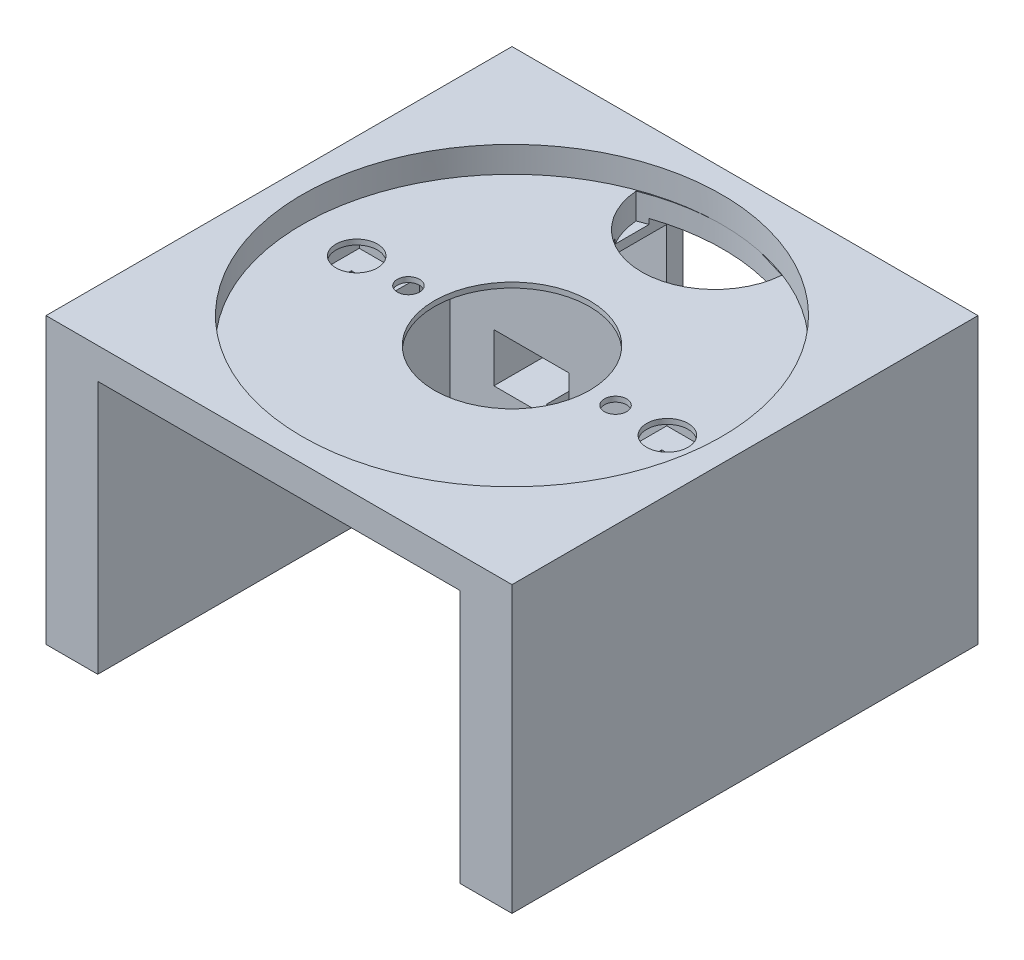
from build123d import *

# Parameters (mm, degrees)
BOSS_EXTRUDE1_DEPTH = 10
SKETCH2_R           = 40.5
CUT_EXTRUDE1_DEPTH  = 5
SKETCH4_R           = 2.15
CUT_EXTRUDE2_DEPTH  = 2
SKETCH5_R           = 15
CUT_EXTRUDE3_DEPTH  = 64.835726674
CUT_EXTRUDE4_DEPTH  = 66
SKETCH8_W           = 90
SKETCH8_H           = 90
BOSS_EXTRUDE2_DEPTH = 45
SKETCH9_W           = 70
SKETCH9_H           = 49
CUT_EXTRUDE5_DEPTH  = 68
CUT_EXTRUDE7_DEPTH  = 20
SKETCH12_W          = 0.314102564
SKETCH12_H          = 2.557692307
SKETCH12_H_2        = 3.589743589
SKETCH12_H_3        = 2.557692308
CUT_EXTRUDE9_DEPTH  = 4
CUT_EXTRUDE12_DEPTH = 2.5
SKETCH18_R          = 11.15
CUT_EXTRUDE13_DEPTH = 4.66
SKETCH20_W          = 13.66
SKETCH20_H          = 24.8
CUT_EXTRUDE14_DEPTH = 14.5
SKETCH22_R          = 1.45
BOSS_EXTRUDE3_DEPTH = 9
SKETCH24_W          = 13.66
SKETCH24_H          = 24.8
SKETCH24_R          = 1.45
CUT_EXTRUDE16_DEPTH = 14.5
CUT_EXTRUDE29_DEPTH = 10
SKETCH32_W          = 5.302834592
SKETCH32_H          = 4.66
CUT_EXTRUDE21_DEPTH = 10
SKETCH33_R          = 4
CUT_EXTRUDE22_DEPTH = 10
BOSS_EXTRUDE5_DEPTH = 10.61
BOSS_EXTRUDE6_DEPTH = 10.61
SKETCH43_W          = 4.11
SKETCH43_H          = 1.9
CUT_EXTRUDE30_DEPTH = 7.5


with BuildPart() as part:
    # Sketch1 → Boss-Extrude1 (new body)
    with BuildSketch(Plane(origin=(0, 0, 0), x_dir=(1, 0, 0), z_dir=(0, 1, 0))):
        Polygon((0, -45), (-45, -45), (-45, 45), (0, 45), (45, 45), (45, -45), align=None)
    extrude(amount=BOSS_EXTRUDE1_DEPTH)

    # Sketch2 → Cut-Extrude1 (cut)
    with BuildSketch(Plane(origin=(0, 10, 0), x_dir=(1, 0, 0), z_dir=(0, 1, 0))):
        Circle(SKETCH2_R)
    extrude(amount=-CUT_EXTRUDE1_DEPTH, mode=Mode.SUBTRACT)

    # Sketch4 → Cut-Extrude2 (cut)
    with BuildSketch(Plane(origin=(0, 5, 0), x_dir=(1, 0, 0), z_dir=(0, 1, 0))):
        with Locations((-20, 0)):
            Circle(SKETCH4_R)
        with Locations((20, 0)):
            Circle(SKETCH4_R)
    extrude(amount=-CUT_EXTRUDE2_DEPTH, mode=Mode.SUBTRACT)

    # Sketch5 → Cut-Extrude3 (cut, through all)
    with BuildSketch(Plane(origin=(0, 5, 0), x_dir=(1, 0, 0), z_dir=(0, 1, 0))):
        Circle(SKETCH5_R)
    extrude(amount=-CUT_EXTRUDE3_DEPTH, mode=Mode.SUBTRACT)

    # Sketch7 → Cut-Extrude4 (cut)
    with BuildSketch(Plane(origin=(0, 5, 0), x_dir=(1, 0, 0), z_dir=(0, 1, 0))):
        with BuildLine():
            ThreePointArc((-13.841521615, 37.800491998), (0.234545088, 24.817118498), (14.31061179, 37.800491998))
            ThreePointArc((14.31061179, 37.800491998), (0.234545088, 40.503688372), (-13.841521615, 37.800491998))
        make_face()
    extrude(amount=-CUT_EXTRUDE4_DEPTH, mode=Mode.SUBTRACT)

    # Sketch8 → Boss-Extrude2 (add)
    with BuildSketch(Plane.XZ):
        Rectangle(SKETCH8_W, SKETCH8_H)
    extrude(amount=BOSS_EXTRUDE2_DEPTH)

    # Sketch9 → Cut-Extrude5 (cut)
    with BuildSketch(Plane.XY.offset(45)):
        with Locations((0, -20.5)):
            Rectangle(SKETCH9_W, SKETCH9_H)
    extrude(amount=-CUT_EXTRUDE5_DEPTH, mode=Mode.SUBTRACT)

    # Sketch10 → Cut-Extrude7 (cut)
    with BuildSketch(Plane(origin=(0, 0, -45), x_dir=(-1, 0, 0), z_dir=(0, 0, -1))):
        Polygon((-12, -21), (-12, -25), (-18, -25), (-18, -37), (18.337886809, -37), (18.337886809, -25), (12, -25), (12, 1), (-12, 1), (-12, -2), align=None)
    extrude(amount=-CUT_EXTRUDE7_DEPTH, mode=Mode.SUBTRACT)

    # Sketch12 → Cut-Extrude9 (cut)
    # profile 1 of 26: a face of its own
    with BuildSketch(Plane(origin=(0, 0, -45), x_dir=(-1, 0, 0), z_dir=(0, 0, -1))):
        with BuildLine():
            Line((-41.236340785, 0.241616987), (-40.549942548, 0.241616987))
            add(Edge.make_bspline(
                [(-40.549942548, 0.241616987), (-40.502731642, 0.24156509), (-40.412273449, 0.241465655), (-40.282558393, 0.238450909), (-40.164748661, 0.234424217), (-40.059098281, 0.228842324), (-39.965282182, 0.222245734), (-39.883724883, 0.212993694), (-39.813785327, 0.203333399), (-39.771878877, 0.193511992), (-39.752767067, 0.189032852)],
                knots=[0, 0, 0, 0, 1.415646017, 2.712440637, 3.8905458, 4.950247383, 5.884950622, 6.709939814, 7.411656543, 8, 8, 8, 8], degree=3))
            add(Edge.make_bspline(
                [(-39.752767067, 0.189032852), (-39.728573533, 0.182410902), (-39.680756556, 0.169323041), (-39.611855513, 0.143109317), (-39.546301667, 0.112027152), (-39.483870109, 0.076603212), (-39.425328026, 0.035317648), (-39.369801985, -0.01015597), (-39.317782005, -0.060867538), (-39.269560613, -0.116248278), (-39.225275815, -0.175368488), (-39.187146132, -0.239110718), (-39.155218905, -0.306402022), (-39.127835634, -0.377195593), (-39.108127179, -0.452085916), (-39.09328028, -0.530552629), (-39.083856652, -0.612587319), (-39.08295409, -0.668647186), (-39.082494631, -0.697185097)],
                knots=[0, 0, 0, 0, 0.999701418, 1.975846123, 2.934577507, 3.890451536, 4.834027766, 5.787354733, 6.749476667, 7.726910423, 8.712836071, 9.690891519, 10.682875813, 11.679750201, 12.712814741, 13.765529915, 14.8625177, 16, 16, 16, 16], degree=3))
            add(Edge.make_bspline(
                [(-39.082494631, -0.697185097), (-39.082916056, -0.725962873), (-39.083740602, -0.782268537), (-39.093636887, -0.864641326), (-39.106967079, -0.943359716), (-39.127464131, -1.018249166), (-39.154309804, -1.088864937), (-39.185801857, -1.156286169), (-39.223785387, -1.219365841), (-39.267430217, -1.278332958), (-39.315981811, -1.33324287), (-39.36923475, -1.383697665), (-39.426974042, -1.429402003), (-39.48901619, -1.470458347), (-39.555966039, -1.505914627), (-39.626808193, -1.537671931), (-39.702158409, -1.564342992), (-39.754300923, -1.578373054), (-39.780811939, -1.585506411)],
                knots=[0, 0, 0, 0, 1.121902311, 2.195077645, 3.232258892, 4.234102512, 5.217864754, 6.176164875, 7.132989551, 8.084763148, 9.034132444, 9.988522005, 10.94243251, 11.903244335, 12.886203696, 13.894208494, 14.929344452, 16, 16, 16, 16], degree=3))
            add(Edge.make_bspline(
                [(-39.780811939, -1.585506411), (-39.802739273, -1.590169392), (-39.8507943, -1.600388586), (-39.929937022, -1.611797043), (-40.022082408, -1.621534644), (-40.127104688, -1.628835781), (-40.244909593, -1.63508615), (-40.37556085, -1.640054243), (-40.519314928, -1.642784097), (-40.619586172, -1.64292489), (-40.67193774, -1.642998398)],
                knots=[0, 0, 0, 0, 0.601384939, 1.31797006, 2.144135048, 3.087295005, 4.142315834, 5.309527816, 6.595305764, 8, 8, 8, 8], degree=3))
            Line((-40.67193774, -1.642998398), (-40.922238221, -1.642998398))
            Line((-40.922238221, -1.642998398), (-40.922238221, -3.258383013))
            Line((-40.922238221, -3.258383013), (-41.236340785, -3.258383013))
            Line((-41.236340785, -3.258383013), (-41.236340785, 0.241616987))
        make_face()
        with BuildLine():
            Line((-40.922238221, -0.117357372), (-40.922238221, -1.284024039))
            Line((-40.922238221, -1.284024039), (-40.309457772, -1.291736379))
            add(Edge.make_bspline(
                [(-40.309457772, -1.291736379), (-40.279537846, -1.291751842), (-40.221778046, -1.291781694), (-40.138341823, -1.287796471), (-40.060932536, -1.283195938), (-39.98978796, -1.276460015), (-39.924876026, -1.266938757), (-39.866088497, -1.257327019), (-39.813881214, -1.243421657), (-39.752782012, -1.224698588), (-39.684698665, -1.192765972), (-39.610631116, -1.146416082), (-39.54786053, -1.087335374), (-39.493542233, -1.020907542), (-39.450436355, -0.947008413), (-39.418880363, -0.867939476), (-39.400339206, -0.784511627), (-39.397853012, -0.727423488), (-39.396597195, -0.69858734)],
                knots=[0, 0, 0, 0, 1.160613943, 2.240541288, 3.23993089, 4.169200891, 5.011653406, 5.7853311, 6.478053781, 7.106038997, 8.262395093, 9.384106736, 10.481365981, 11.59014053, 12.70357646, 13.786202915, 14.881775077, 16, 16, 16, 16], degree=3))
            add(Edge.make_bspline(
                [(-39.396597195, -0.69858734), (-39.397859842, -0.670448827), (-39.400369827, -0.614512945), (-39.41902569, -0.532534184), (-39.450375004, -0.45429848), (-39.493831598, -0.381325394), (-39.546572728, -0.31513659), (-39.607872071, -0.257639463), (-39.677585333, -0.211417761), (-39.742433564, -0.181584479), (-39.80003475, -0.163369203), (-39.85006671, -0.150624363), (-39.906557384, -0.140448757), (-39.969525164, -0.132209254), (-40.038481997, -0.125155793), (-40.114020312, -0.120369815), (-40.195853956, -0.117568359), (-40.252664526, -0.117429404), (-40.282114022, -0.117357372)],
                knots=[0, 0, 0, 0, 1.120700087, 2.227813068, 3.331159281, 4.466773991, 5.599788987, 6.693661531, 7.80175334, 8.91857717, 9.525282508, 10.207424825, 10.974604443, 11.810962634, 12.737642355, 13.736264703, 14.826523623, 16, 16, 16, 16], degree=3))
            Line((-40.282114022, -0.117357372), (-40.922238221, -0.117357372))
        make_face(mode=Mode.SUBTRACT)
    # profile 2 of 26: a face of its own
    with BuildSketch(Plane(origin=(0, 0, -45), x_dir=(-1, 0, 0), z_dir=(0, 0, -1))):
        with BuildLine():
            Line((-38.544033093, -0.700690706), (-38.229930529, -0.700690706))
            Line((-38.229930529, -0.700690706), (-38.229930529, -1.077193109))
            add(Edge.make_bspline(
                [(-38.229930529, -1.077193109), (-38.20674177, -1.042137281), (-38.162393449, -0.975093282), (-38.08868052, -0.886423981), (-38.013177188, -0.813008934), (-37.935522001, -0.754505415), (-37.855143901, -0.710692297), (-37.773806949, -0.678599262), (-37.690231479, -0.659621946), (-37.634069555, -0.657088287), (-37.605932131, -0.655818911)],
                knots=[0, 0, 0, 0, 1.2804753, 2.448899062, 3.506932113, 4.484331642, 5.4025378, 6.288909075, 7.142734305, 8, 8, 8, 8], degree=3))
            add(Edge.make_bspline(
                [(-37.605932131, -0.655818911), (-37.584105805, -0.657009437), (-37.539196719, -0.659459023), (-37.47121413, -0.676669848), (-37.401170678, -0.70414787), (-37.35602829, -0.729988093), (-37.332494631, -0.743459135)],
                knots=[0, 0, 0, 0, 0.901110191, 1.854092781, 2.881294221, 4, 4, 4, 4], degree=3))
            Line((-37.332494631, -0.743459135), (-37.504970593, -1.015494392))
            add(Edge.make_bspline(
                [(-37.504970593, -1.015494392), (-37.520079614, -1.008754125), (-37.548759428, -0.99595981), (-37.590713995, -0.9808178), (-37.629395331, -0.971901884), (-37.65403889, -0.970551167), (-37.665527484, -0.969921475)],
                knots=[0, 0, 0, 0, 1.180555205, 2.24091978, 3.179933427, 4, 4, 4, 4], degree=3))
            add(Edge.make_bspline(
                [(-37.665527484, -0.969921475), (-37.690733217, -0.971601512), (-37.742145607, -0.975028301), (-37.817630107, -1.001967109), (-37.890877312, -1.045492349), (-37.949048974, -1.093763461), (-37.994091227, -1.140311259), (-38.026231453, -1.180959661), (-38.0557142, -1.226538293), (-38.08388442, -1.276267977), (-38.109550714, -1.330997823), (-38.133505384, -1.390181036), (-38.155164246, -1.453886165), (-38.167514491, -1.498268685), (-38.173840785, -1.521003206)],
                knots=[0, 0, 0, 0, 1.125678352, 2.296057538, 3.5422874, 4.923748041, 5.663163013, 6.437101912, 7.23742474, 8.08941207, 8.991984279, 9.93940061, 10.944477711, 12, 12, 12, 12], degree=3))
            add(Edge.make_bspline(
                [(-38.173840785, -1.521003206), (-38.178573178, -1.541280379), (-38.18905507, -1.586192778), (-38.199246608, -1.661541303), (-38.209316126, -1.750564961), (-38.216412744, -1.853511554), (-38.222990786, -1.970123998), (-38.226700869, -2.100579944), (-38.229804009, -2.245013295), (-38.229887076, -2.345987648), (-38.229930529, -2.398807693)],
                knots=[0, 0, 0, 0, 0.566838948, 1.255505196, 2.06880316, 3.007127437, 4.065329342, 5.249902469, 6.561414163, 8, 8, 8, 8], degree=3))
            Line((-38.229930529, -2.398807693), (-38.229930529, -3.258383013))
            Line((-38.229930529, -3.258383013), (-38.544033093, -3.258383013))
            Line((-38.544033093, -3.258383013), (-38.544033093, -0.700690706))
        make_face()
    # profile 3 of 26: a face of its own
    with BuildSketch(Plane(origin=(0, 0, -45), x_dir=(-1, 0, 0), z_dir=(0, 0, -1))):
        with BuildLine():
            add(Edge.make_bspline(
                [(-35.783015464, -0.655818911), (-35.735024192, -0.656840802), (-35.640925034, -0.658844481), (-35.503117148, -0.680259446), (-35.371572012, -0.713006811), (-35.24578582, -0.758278373), (-35.127369525, -0.818960323), (-35.01459828, -0.891369614), (-34.907781272, -0.977152208), (-34.843758242, -1.043510276), (-34.811260657, -1.077193109)],
                knots=[0, 0, 0, 0, 1.054011418, 2.066658804, 3.057071809, 4.030435133, 4.997543892, 5.974964718, 6.972108034, 8, 8, 8, 8], degree=3))
            add(Edge.make_bspline(
                [(-34.811260657, -1.077193109), (-34.783278703, -1.109407095), (-34.727856322, -1.173211637), (-34.656790604, -1.27666725), (-34.595569044, -1.383807351), (-34.546506083, -1.496054678), (-34.507821059, -1.612429349), (-34.480355363, -1.73333136), (-34.464018428, -1.858493707), (-34.461815461, -1.943497545), (-34.460699759, -1.986548077)],
                knots=[0, 0, 0, 0, 1.025258237, 2.030674902, 3.01204498, 3.988269485, 4.97094183, 5.956517959, 6.965070386, 8, 8, 8, 8], degree=3))
            add(Edge.make_bspline(
                [(-34.460699759, -1.986548077), (-34.461681097, -2.029848135), (-34.463620265, -2.115411068), (-34.481963881, -2.241430434), (-34.510494967, -2.363625257), (-34.551326805, -2.481483951), (-34.603684915, -2.595366778), (-34.667575602, -2.704776327), (-34.743447219, -2.809928461), (-34.829451216, -2.909930299), (-34.924503092, -3.002096514), (-35.027619241, -3.082424783), (-35.136773274, -3.151246308), (-35.253416628, -3.206682723), (-35.376484114, -3.250392424), (-35.506241183, -3.28109244), (-35.642486253, -3.299654124), (-35.735513474, -3.302037697), (-35.783015464, -3.303254808)],
                knots=[0, 0, 0, 0, 0.998656419, 1.973391657, 2.932242238, 3.890759089, 4.846373663, 5.82037756, 6.809684879, 7.83454468, 8.860553229, 9.859544525, 10.845671541, 11.83227036, 12.833544569, 13.85385346, 14.904124723, 16, 16, 16, 16], degree=3))
            add(Edge.make_bspline(
                [(-35.783015464, -3.303254808), (-35.830750184, -3.302033612), (-35.924241044, -3.299641837), (-36.060967026, -3.281164555), (-36.190956645, -3.250406572), (-36.314185243, -3.206539079), (-36.43133009, -3.151244536), (-36.541116587, -3.082632846), (-36.644316502, -3.002072691), (-36.739388487, -2.909936754), (-36.825387092, -2.809926798), (-36.901260101, -2.704776759), (-36.965150427, -2.595366666), (-37.017508631, -2.481483981), (-37.058340444, -2.363625249), (-37.086871536, -2.241430436), (-37.105215151, -2.115411068), (-37.107154319, -2.029848135), (-37.108135657, -1.986548077)],
                knots=[0, 0, 0, 0, 1.099876186, 2.154163076, 3.173186993, 4.173200201, 5.163417411, 6.152872554, 7.150605724, 8.17532212, 9.198891216, 10.186952605, 11.159729845, 12.11414092, 13.071450619, 14.029093627, 15.002601286, 16, 16, 16, 16], degree=3))
            add(Edge.make_bspline(
                [(-37.108135657, -1.986548077), (-37.107012346, -1.943731532), (-37.104788385, -1.858962129), (-37.088467876, -1.734035068), (-37.061109319, -1.613337679), (-37.022377923, -1.497412203), (-36.972862732, -1.385656767), (-36.912501444, -1.278251936), (-36.840710812, -1.175264136), (-36.78550886, -1.111542056), (-36.757574759, -1.079296475)],
                knots=[0, 0, 0, 0, 1.031353054, 2.041901799, 3.029428768, 4.008703097, 4.981709435, 5.96992636, 6.972712378, 8, 8, 8, 8], degree=3))
            add(Edge.make_bspline(
                [(-36.757574759, -1.079296475), (-36.725126168, -1.045321536), (-36.661310304, -0.978503839), (-36.553961577, -0.892971315), (-36.441467756, -0.819055241), (-36.321742829, -0.759579026), (-36.196059972, -0.712740508), (-36.063840729, -0.680174993), (-35.925565214, -0.658921638), (-35.831005592, -0.65686346), (-35.783015464, -0.655818911)],
                knots=[0, 0, 0, 0, 1.027980169, 2.021703884, 2.998553061, 3.971491411, 4.943284454, 5.930300938, 6.949603206, 8, 8, 8, 8], degree=3))
        make_face()
        with BuildLine():
            add(Edge.make_bspline(
                [(-35.784417708, -0.969921475), (-35.818355319, -0.970886067), (-35.885354448, -0.972790349), (-35.983974033, -0.987274254), (-36.078914187, -1.010221758), (-36.170355031, -1.042825814), (-36.257988203, -1.084924713), (-36.341897606, -1.136633073), (-36.422330046, -1.19726603), (-36.497712109, -1.266728701), (-36.566894421, -1.342607696), (-36.627372398, -1.423456055), (-36.678797504, -1.507962401), (-36.721637663, -1.596214612), (-36.753544851, -1.689107026), (-36.776717874, -1.785587657), (-36.791188114, -1.885853074), (-36.793074493, -1.954014092), (-36.794033093, -1.988651443)],
                knots=[0, 0, 0, 0, 1.021534396, 2.016698045, 2.994645724, 3.958388632, 4.93408049, 5.916473867, 6.921342795, 7.962252576, 8.998418191, 10.008913653, 10.997312074, 11.973003931, 12.956656626, 13.948281152, 14.957379055, 16, 16, 16, 16], degree=3))
            add(Edge.make_bspline(
                [(-36.794033093, -1.988651443), (-36.792426269, -2.03340347), (-36.789237025, -2.122227875), (-36.763301788, -2.253038998), (-36.719915508, -2.37862085), (-36.661328229, -2.498237236), (-36.58792201, -2.608909514), (-36.501434943, -2.707580999), (-36.402795243, -2.79276681), (-36.293178743, -2.863447656), (-36.174824425, -2.919607411), (-36.049568104, -2.959406387), (-35.91892741, -2.985278079), (-35.829646678, -2.987849554), (-35.784417708, -2.989152244)],
                knots=[0, 0, 0, 0, 1.016792936, 2.018143844, 3.017858371, 4.030088057, 5.03801393, 6.028138512, 7.003788237, 7.991172063, 8.984598303, 9.972568034, 10.972917682, 12, 12, 12, 12], degree=3))
            add(Edge.make_bspline(
                [(-35.784417708, -2.989152244), (-35.739191339, -2.987841964), (-35.649915743, -2.985255507), (-35.519456566, -2.959536687), (-35.394542594, -2.919433027), (-35.276311207, -2.863510817), (-35.166744603, -2.792498402), (-35.067395482, -2.708062025), (-34.981646871, -2.608648173), (-34.908313266, -2.498090645), (-34.848766523, -2.378806293), (-34.805583322, -2.25301582), (-34.779585736, -2.122233778), (-34.776404907, -2.033405448), (-34.774802323, -1.988651443)],
                knots=[0, 0, 0, 0, 1.02726834, 2.027799167, 3.010890988, 4.004497153, 4.992059811, 5.971914811, 6.958719428, 7.966827853, 8.981595046, 9.981490638, 10.983022906, 12, 12, 12, 12], degree=3))
            add(Edge.make_bspline(
                [(-34.774802323, -1.988651443), (-34.775760593, -1.954013885), (-34.777646323, -1.885852459), (-34.792121287, -1.785590006), (-34.815276827, -1.689098409), (-34.847248444, -1.596246406), (-34.889902458, -1.507733902), (-34.942319251, -1.423704175), (-35.002550276, -1.342327629), (-35.072567397, -1.266973988), (-35.147870775, -1.197238951), (-35.228335813, -1.136609562), (-35.312120792, -1.085151966), (-35.399499374, -1.042465726), (-35.490951942, -1.010518385), (-35.585759071, -0.987141754), (-35.683957881, -0.972851557), (-35.750716924, -0.970904416), (-35.784417708, -0.969921475)],
                knots=[0, 0, 0, 0, 1.042956736, 2.052379634, 3.044323526, 4.02829302, 5.004299113, 5.996692471, 7.007513377, 8.048758398, 9.090003419, 10.095195979, 11.07790575, 12.047570684, 13.018257071, 13.989683339, 14.985167495, 16, 16, 16, 16], degree=3))
        make_face(mode=Mode.SUBTRACT)
    # profile 4 of 26: a face of its own
    with BuildSketch(Plane(origin=(0, 0, -45), x_dir=(-1, 0, 0), z_dir=(0, 0, -1))):
        Polygon((-33.518392067, 0.331360576), (-33.204289503, 0.331360576), (-33.204289503, -0.700690706), (-32.755571554, -0.700690706), (-32.755571554, -1.01479327), (-33.204289503, -1.01479327), (-33.204289503, -3.258383013), (-33.518392067, -3.258383013), (-33.518392067, -1.01479327), (-33.967110016, -1.01479327), (-33.967110016, -0.700690706), (-33.518392067, -0.700690706), align=None)
    # profile 5 of 26: a face of its own
    with BuildSketch(Plane(origin=(0, 0, -45), x_dir=(-1, 0, 0), z_dir=(0, 0, -1))):
        with BuildLine():
            add(Edge.make_bspline(
                [(-30.981733413, -0.655818911), (-30.93374214, -0.656840802), (-30.839642983, -0.658844481), (-30.701835097, -0.680259446), (-30.570289961, -0.713006811), (-30.444503769, -0.758278373), (-30.326087473, -0.818960323), (-30.213316229, -0.891369614), (-30.10649922, -0.977152208), (-30.042476191, -1.043510276), (-30.009978605, -1.077193109)],
                knots=[0, 0, 0, 0, 1.054011418, 2.066658804, 3.057071809, 4.030435133, 4.997543892, 5.974964718, 6.972108034, 8, 8, 8, 8], degree=3))
            add(Edge.make_bspline(
                [(-30.009978605, -1.077193109), (-29.981996651, -1.109407095), (-29.926574271, -1.173211637), (-29.855508552, -1.27666725), (-29.794286992, -1.383807351), (-29.745224031, -1.496054678), (-29.706539008, -1.612429349), (-29.679073311, -1.73333136), (-29.662736376, -1.858493707), (-29.660533409, -1.943497545), (-29.659417708, -1.986548077)],
                knots=[0, 0, 0, 0, 1.025258237, 2.030674902, 3.01204498, 3.988269485, 4.97094183, 5.956517959, 6.965070386, 8, 8, 8, 8], degree=3))
            add(Edge.make_bspline(
                [(-29.659417708, -1.986548077), (-29.660399045, -2.029848135), (-29.662338214, -2.115411068), (-29.68068183, -2.241430434), (-29.709212916, -2.363625257), (-29.750044754, -2.481483951), (-29.802402863, -2.595366778), (-29.866293551, -2.704776327), (-29.942165168, -2.809928461), (-30.028169165, -2.909930299), (-30.123221041, -3.002096514), (-30.226337189, -3.082424783), (-30.335491223, -3.151246308), (-30.452134576, -3.206682723), (-30.575202063, -3.250392424), (-30.704959131, -3.28109244), (-30.841204202, -3.299654124), (-30.934231423, -3.302037697), (-30.981733413, -3.303254808)],
                knots=[0, 0, 0, 0, 0.998656419, 1.973391657, 2.932242238, 3.890759089, 4.846373663, 5.82037756, 6.809684879, 7.83454468, 8.860553229, 9.859544525, 10.845671541, 11.83227036, 12.833544569, 13.85385346, 14.904124723, 16, 16, 16, 16], degree=3))
            add(Edge.make_bspline(
                [(-30.981733413, -3.303254808), (-31.029468133, -3.302033612), (-31.122958992, -3.299641837), (-31.259684974, -3.281164555), (-31.389674593, -3.250406572), (-31.512903192, -3.206539079), (-31.630048039, -3.151244536), (-31.739834536, -3.082632846), (-31.843034451, -3.002072691), (-31.938106436, -2.909936754), (-32.024105041, -2.809926798), (-32.099978049, -2.704776759), (-32.163868375, -2.595366666), (-32.216226579, -2.481483981), (-32.257058392, -2.363625249), (-32.285589485, -2.241430436), (-32.303933099, -2.115411068), (-32.305872268, -2.029848135), (-32.306853605, -1.986548077)],
                knots=[0, 0, 0, 0, 1.099876186, 2.154163076, 3.173186993, 4.173200201, 5.163417411, 6.152872554, 7.150605724, 8.17532212, 9.198891216, 10.186952605, 11.159729845, 12.11414092, 13.071450619, 14.029093627, 15.002601286, 16, 16, 16, 16], degree=3))
            add(Edge.make_bspline(
                [(-32.306853605, -1.986548077), (-32.305730295, -1.943731532), (-32.303506334, -1.858962129), (-32.287185825, -1.734035068), (-32.259827268, -1.613337679), (-32.221095872, -1.497412203), (-32.171580681, -1.385656767), (-32.111219393, -1.278251936), (-32.03942876, -1.175264136), (-31.984226809, -1.111542056), (-31.956292708, -1.079296475)],
                knots=[0, 0, 0, 0, 1.031353054, 2.041901799, 3.029428768, 4.008703097, 4.981709435, 5.96992636, 6.972712378, 8, 8, 8, 8], degree=3))
            add(Edge.make_bspline(
                [(-31.956292708, -1.079296475), (-31.923844117, -1.045321536), (-31.860028253, -0.978503839), (-31.752679525, -0.892971315), (-31.640185704, -0.819055241), (-31.520460778, -0.759579026), (-31.39477792, -0.712740508), (-31.262558678, -0.680174993), (-31.124283162, -0.658921638), (-31.029723541, -0.65686346), (-30.981733413, -0.655818911)],
                knots=[0, 0, 0, 0, 1.027980169, 2.021703884, 2.998553061, 3.971491411, 4.943284454, 5.930300938, 6.949603206, 8, 8, 8, 8], degree=3))
        make_face()
        with BuildLine():
            add(Edge.make_bspline(
                [(-30.983135657, -0.969921475), (-31.017073268, -0.970886067), (-31.084072397, -0.972790349), (-31.182691981, -0.987274254), (-31.277632135, -1.010221758), (-31.36907298, -1.042825814), (-31.456706152, -1.084924713), (-31.540615554, -1.136633073), (-31.621047994, -1.19726603), (-31.696430058, -1.266728701), (-31.76561237, -1.342607696), (-31.826090346, -1.423456055), (-31.877515453, -1.507962401), (-31.920355612, -1.596214612), (-31.9522628, -1.689107026), (-31.975435822, -1.785587657), (-31.989906063, -1.885853074), (-31.991792441, -1.954014092), (-31.992751041, -1.988651443)],
                knots=[0, 0, 0, 0, 1.021534396, 2.016698045, 2.994645724, 3.958388632, 4.93408049, 5.916473867, 6.921342795, 7.962252576, 8.998418191, 10.008913653, 10.997312074, 11.973003931, 12.956656626, 13.948281152, 14.957379055, 16, 16, 16, 16], degree=3))
            add(Edge.make_bspline(
                [(-31.992751041, -1.988651443), (-31.991144218, -2.03340347), (-31.987954973, -2.122227875), (-31.962019737, -2.253038998), (-31.918633457, -2.37862085), (-31.860046177, -2.498237236), (-31.786639959, -2.608909514), (-31.700152892, -2.707580999), (-31.601513192, -2.79276681), (-31.491896691, -2.863447656), (-31.373542373, -2.919607411), (-31.248286052, -2.959406387), (-31.117645358, -2.985278079), (-31.028364627, -2.987849554), (-30.983135657, -2.989152244)],
                knots=[0, 0, 0, 0, 1.016792936, 2.018143844, 3.017858371, 4.030088057, 5.03801393, 6.028138512, 7.003788237, 7.991172063, 8.984598303, 9.972568034, 10.972917682, 12, 12, 12, 12], degree=3))
            add(Edge.make_bspline(
                [(-30.983135657, -2.989152244), (-30.937909288, -2.987841964), (-30.848633692, -2.985255507), (-30.718174515, -2.959536687), (-30.593260543, -2.919433027), (-30.475029156, -2.863510817), (-30.365462552, -2.792498402), (-30.266113431, -2.708062025), (-30.18036482, -2.608648173), (-30.107031215, -2.498090645), (-30.047484472, -2.378806293), (-30.00430127, -2.25301582), (-29.978303684, -2.122233778), (-29.975122856, -2.033405448), (-29.973520272, -1.988651443)],
                knots=[0, 0, 0, 0, 1.02726834, 2.027799167, 3.010890988, 4.004497153, 4.992059811, 5.971914811, 6.958719428, 7.966827853, 8.981595046, 9.981490638, 10.983022906, 12, 12, 12, 12], degree=3))
            add(Edge.make_bspline(
                [(-29.973520272, -1.988651443), (-29.974478542, -1.954013885), (-29.976364271, -1.885852459), (-29.990839236, -1.785590006), (-30.013994775, -1.689098409), (-30.045966393, -1.596246406), (-30.088620406, -1.507733902), (-30.1410372, -1.423704175), (-30.201268225, -1.342327629), (-30.271285346, -1.266973988), (-30.346588724, -1.197238951), (-30.427053762, -1.136609562), (-30.51083874, -1.085151966), (-30.598217323, -1.042465726), (-30.689669891, -1.010518385), (-30.78447702, -0.987141754), (-30.88267583, -0.972851557), (-30.949434873, -0.970904416), (-30.983135657, -0.969921475)],
                knots=[0, 0, 0, 0, 1.042956736, 2.052379634, 3.044323526, 4.02829302, 5.004299113, 5.996692471, 7.007513377, 8.048758398, 9.090003419, 10.095195979, 11.07790575, 12.047570684, 13.018257071, 13.989683339, 14.985167495, 16, 16, 16, 16], degree=3))
        make_face(mode=Mode.SUBTRACT)
    # profile 6 of 26: a face of its own
    with BuildSketch(Plane(origin=(0, 0, -45), x_dir=(-1, 0, 0), z_dir=(0, 0, -1))):
        with BuildLine():
            Line((-28.94146899, 0.241616987), (-28.255070753, 0.241616987))
            add(Edge.make_bspline(
                [(-28.255070753, 0.241616987), (-28.207859847, 0.24156509), (-28.117401654, 0.241465655), (-27.987686598, 0.238450909), (-27.869876867, 0.234424217), (-27.764226486, 0.228842324), (-27.670410388, 0.222245734), (-27.588853088, 0.212993694), (-27.518913532, 0.203333399), (-27.477007082, 0.193511992), (-27.457895272, 0.189032852)],
                knots=[0, 0, 0, 0, 1.415646017, 2.712440637, 3.8905458, 4.950247383, 5.884950622, 6.709939814, 7.411656543, 8, 8, 8, 8], degree=3))
            add(Edge.make_bspline(
                [(-27.457895272, 0.189032852), (-27.433701738, 0.182410902), (-27.385884761, 0.169323041), (-27.316983718, 0.143109317), (-27.251429873, 0.112027152), (-27.188998314, 0.076603212), (-27.130456231, 0.035317648), (-27.07493019, -0.01015597), (-27.02291021, -0.060867538), (-26.974688818, -0.116248278), (-26.93040402, -0.175368488), (-26.892274338, -0.239110718), (-26.860347111, -0.306402022), (-26.832963839, -0.377195593), (-26.813255385, -0.452085916), (-26.798408485, -0.530552629), (-26.788984857, -0.612587319), (-26.788082296, -0.668647186), (-26.787622836, -0.697185097)],
                knots=[0, 0, 0, 0, 0.999701418, 1.975846123, 2.934577507, 3.890451536, 4.834027766, 5.787354733, 6.749476667, 7.726910423, 8.712836071, 9.690891519, 10.682875813, 11.679750201, 12.712814741, 13.765529915, 14.8625177, 16, 16, 16, 16], degree=3))
            add(Edge.make_bspline(
                [(-26.787622836, -0.697185097), (-26.788044261, -0.725962873), (-26.788868807, -0.782268537), (-26.798765092, -0.864641326), (-26.812095284, -0.943359716), (-26.832592336, -1.018249166), (-26.859438009, -1.088864937), (-26.890930062, -1.156286169), (-26.928913593, -1.219365841), (-26.972558422, -1.278332958), (-27.021110017, -1.33324287), (-27.074362955, -1.383697665), (-27.132102247, -1.429402003), (-27.194144395, -1.470458347), (-27.261094244, -1.505914627), (-27.331936398, -1.537671931), (-27.407286614, -1.564342992), (-27.459429128, -1.578373054), (-27.485940144, -1.585506411)],
                knots=[0, 0, 0, 0, 1.121902311, 2.195077645, 3.232258892, 4.234102512, 5.217864754, 6.176164875, 7.132989551, 8.084763148, 9.034132444, 9.988522005, 10.94243251, 11.903244335, 12.886203696, 13.894208494, 14.929344452, 16, 16, 16, 16], degree=3))
            add(Edge.make_bspline(
                [(-27.485940144, -1.585506411), (-27.507867478, -1.590169392), (-27.555922505, -1.600388586), (-27.635065227, -1.611797043), (-27.727210613, -1.621534644), (-27.832232893, -1.628835781), (-27.950037798, -1.63508615), (-28.080689056, -1.640054243), (-28.224443133, -1.642784097), (-28.324714377, -1.64292489), (-28.377065945, -1.642998398)],
                knots=[0, 0, 0, 0, 0.601384939, 1.31797006, 2.144135048, 3.087295005, 4.142315834, 5.309527816, 6.595305764, 8, 8, 8, 8], degree=3))
            Line((-28.377065945, -1.642998398), (-28.627366426, -1.642998398))
            Line((-28.627366426, -1.642998398), (-28.627366426, -3.258383013))
            Line((-28.627366426, -3.258383013), (-28.94146899, -3.258383013))
            Line((-28.94146899, -3.258383013), (-28.94146899, 0.241616987))
        make_face()
        with BuildLine():
            Line((-28.627366426, -0.117357372), (-28.627366426, -1.284024039))
            Line((-28.627366426, -1.284024039), (-28.014585977, -1.291736379))
            add(Edge.make_bspline(
                [(-28.014585977, -1.291736379), (-27.984666051, -1.291751842), (-27.926906252, -1.291781694), (-27.843470028, -1.287796471), (-27.766060741, -1.283195938), (-27.694916166, -1.276460015), (-27.630004231, -1.266938757), (-27.571216702, -1.257327019), (-27.519009419, -1.243421657), (-27.457910218, -1.224698588), (-27.38982687, -1.192765972), (-27.315759322, -1.146416082), (-27.252988735, -1.087335374), (-27.198670438, -1.020907542), (-27.155564561, -0.947008413), (-27.124008568, -0.867939476), (-27.105467411, -0.784511627), (-27.102981217, -0.727423488), (-27.1017254, -0.69858734)],
                knots=[0, 0, 0, 0, 1.160613943, 2.240541288, 3.23993089, 4.169200891, 5.011653406, 5.7853311, 6.478053781, 7.106038997, 8.262395093, 9.384106736, 10.481365981, 11.59014053, 12.70357646, 13.786202915, 14.881775077, 16, 16, 16, 16], degree=3))
            add(Edge.make_bspline(
                [(-27.1017254, -0.69858734), (-27.102988047, -0.670448827), (-27.105498032, -0.614512945), (-27.124153895, -0.532534184), (-27.155503209, -0.45429848), (-27.198959803, -0.381325394), (-27.251700933, -0.31513659), (-27.313000276, -0.257639463), (-27.382713538, -0.211417761), (-27.447561769, -0.181584479), (-27.505162955, -0.163369203), (-27.555194915, -0.150624363), (-27.611685589, -0.140448757), (-27.674653369, -0.132209254), (-27.743610203, -0.125155793), (-27.819148517, -0.120369815), (-27.900982161, -0.117568359), (-27.957792732, -0.117429404), (-27.987242227, -0.117357372)],
                knots=[0, 0, 0, 0, 1.120700087, 2.227813068, 3.331159281, 4.466773991, 5.599788987, 6.693661531, 7.80175334, 8.91857717, 9.525282508, 10.207424825, 10.974604443, 11.810962634, 12.737642355, 13.736264703, 14.826523623, 16, 16, 16, 16], degree=3))
            Line((-27.987242227, -0.117357372), (-28.627366426, -0.117357372))
        make_face(mode=Mode.SUBTRACT)
    # profile 7 of 26: a face of its own
    with BuildSketch(Plane(origin=(0, 0, -45), x_dir=(-1, 0, 0), z_dir=(0, 0, -1))):
        with BuildLine():
            add(Edge.make_bspline(
                [(-26.048640464, 0.376232371), (-26.029149149, 0.375328219), (-25.990981409, 0.373557715), (-25.935788141, 0.358396238), (-25.885531129, 0.332696552), (-25.840953396, 0.298216871), (-25.802701509, 0.257667428), (-25.775920799, 0.21040646), (-25.758708403, 0.159347821), (-25.756629848, 0.123732732), (-25.755571554, 0.105599358)],
                knots=[0, 0, 0, 0, 1.055194115, 2.066272739, 3.074728998, 4.095836921, 5.109056067, 6.073838105, 7.019297344, 8, 8, 8, 8], degree=3))
            add(Edge.make_bspline(
                [(-25.755571554, 0.105599358), (-25.756653714, 0.087936705), (-25.758793016, 0.05301973), (-25.775907504, 0.002846258), (-25.802929742, -0.043758025), (-25.840928868, -0.084228735), (-25.885537629, -0.118689355), (-25.935786414, -0.144394094), (-25.990981863, -0.159554232), (-26.029149302, -0.16132492), (-26.048640464, -0.162229167)],
                knots=[0, 0, 0, 0, 0.96129708, 1.900370562, 2.859976407, 3.87933698, 4.906634145, 5.921202961, 6.938410037, 8, 8, 8, 8], degree=3))
            add(Edge.make_bspline(
                [(-26.048640464, -0.162229167), (-26.06790874, -0.161359447), (-26.10541192, -0.15966665), (-26.159778762, -0.144096632), (-26.209607252, -0.118680559), (-26.254271924, -0.084454374), (-26.291502117, -0.043509477), (-26.318600443, 0.002817817), (-26.335675405, 0.053026971), (-26.337820033, 0.087939138), (-26.338904888, 0.105599358)],
                knots=[0, 0, 0, 0, 1.054934014, 2.053291228, 3.073705704, 4.106921865, 5.123545215, 6.088680038, 7.033164197, 8, 8, 8, 8], degree=3))
            add(Edge.make_bspline(
                [(-26.338904888, 0.105599358), (-26.337843801, 0.123730208), (-26.33575976, 0.159340341), (-26.318587644, 0.210435374), (-26.291727836, 0.257416875), (-26.254247272, 0.298442375), (-26.209613812, 0.33268781), (-26.159777067, 0.358098791), (-26.105412368, 0.37367013), (-26.067908892, 0.375362745), (-26.048640464, 0.376232371)],
                knots=[0, 0, 0, 0, 0.98631895, 1.937192651, 2.907499808, 3.917963147, 4.944918757, 5.95915025, 6.951458133, 8, 8, 8, 8], degree=3))
        make_face()
    # profile 8 of 26: a face of its own
    with BuildSketch(Plane(origin=(0, 0, -45), x_dir=(-1, 0, 0), z_dir=(0, 0, -1))):
        with Locations((-26.047238221, -1.97953686)):
            Rectangle(SKETCH12_W, SKETCH12_H)
    # profile 9 of 26: a face of its own
    with BuildSketch(Plane(origin=(0, 0, -45), x_dir=(-1, 0, 0), z_dir=(0, 0, -1))):
        with Locations((-25.015186939, -1.463511218)):
            Rectangle(SKETCH12_W, SKETCH12_H_2)
    # profile 10 of 26: a face of its own
    with BuildSketch(Plane(origin=(0, 0, -45), x_dir=(-1, 0, 0), z_dir=(0, 0, -1))):
        with Locations((-24.028007452, -1.463511218)):
            Rectangle(SKETCH12_W, SKETCH12_H_2)
    # profile 11 of 26: a face of its own
    with BuildSketch(Plane(origin=(0, 0, -45), x_dir=(-1, 0, 0), z_dir=(0, 0, -1))):
        with BuildLine():
            Line((-41.236340785, -10.091716347), (-41.236340785, -6.591716347))
            Line((-41.236340785, -6.591716347), (-40.529610016, -6.591716347))
            add(Edge.make_bspline(
                [(-40.529610016, -6.591716347), (-40.468141028, -6.592158917), (-40.349383262, -6.59301396), (-40.177770815, -6.598435351), (-40.018987052, -6.608025817), (-39.873554193, -6.621995343), (-39.741072981, -6.639148376), (-39.621914373, -6.660648781), (-39.51546223, -6.686036951), (-39.44999279, -6.707682401), (-39.419033093, -6.71791827)],
                knots=[0, 0, 0, 0, 1.314313732, 2.53924729, 3.670748893, 4.714932338, 5.66265055, 6.526160246, 7.303039223, 8, 8, 8, 8], degree=3))
            add(Edge.make_bspline(
                [(-39.419033093, -6.71791827), (-39.378538353, -6.733348975), (-39.298467161, -6.763860469), (-39.184460038, -6.821416771), (-39.077134676, -6.886629873), (-38.975915531, -6.959585735), (-38.883114704, -7.042350084), (-38.795106808, -7.131407169), (-38.715492084, -7.22999551), (-38.642583788, -7.336070498), (-38.576848128, -7.44838255), (-38.51970897, -7.566717658), (-38.472254977, -7.690474867), (-38.43286175, -7.819310015), (-38.401815293, -7.953506392), (-38.380633361, -8.093220258), (-38.366662371, -8.237899448), (-38.36525832, -8.336073912), (-38.364545913, -8.38588702)],
                knots=[0, 0, 0, 0, 0.984719456, 1.947108742, 2.898477687, 3.838006223, 4.779231079, 5.722358779, 6.681677486, 7.655904652, 8.64651281, 9.637519902, 10.640069247, 11.656948941, 12.698408672, 13.768548281, 14.867775369, 16, 16, 16, 16], degree=3))
            add(Edge.make_bspline(
                [(-38.364545913, -8.38588702), (-38.365174881, -8.429148258), (-38.366414327, -8.514399047), (-38.377543643, -8.640039943), (-38.393719963, -8.761953514), (-38.418764161, -8.879559214), (-38.449166674, -8.993887432), (-38.488130825, -9.103719676), (-38.532766321, -9.210063486), (-38.5848162, -9.311480962), (-38.641957585, -9.407564334), (-38.703279328, -9.498139862), (-38.768716024, -9.581915084), (-38.838891656, -9.659143696), (-38.912899373, -9.729709274), (-38.991223704, -9.79420129), (-39.074066754, -9.851357845), (-39.161057477, -9.903424953), (-39.254733606, -9.948845308), (-39.356869472, -9.987275318), (-39.46790065, -10.019121933), (-39.587554607, -10.045692829), (-39.716038085, -10.066770132), (-39.853477051, -10.080896524), (-39.999660341, -10.090449457), (-40.100039606, -10.09128585), (-40.151705368, -10.091716347)],
                knots=[0, 0, 0, 0, 1.105936401, 2.179363191, 3.223086493, 4.248585256, 5.251745608, 6.245858792, 7.225916811, 8.198733463, 9.158002045, 10.082870192, 10.993790845, 11.873723703, 12.748670949, 13.606408763, 14.465103618, 15.319838547, 16.196477973, 17.123216899, 18.106603292, 19.147568657, 20.255746949, 21.433717677, 22.679120308, 24, 24, 24, 24], degree=3))
            Line((-40.151705368, -10.091716347), (-41.236340785, -10.091716347))
        make_face()
        with BuildLine():
            Line((-40.922238221, -9.732741988), (-40.520495432, -9.732741988))
            add(Edge.make_bspline(
                [(-40.520495432, -9.732741988), (-40.462767062, -9.732493891), (-40.351734263, -9.732016711), (-40.192076266, -9.727829508), (-40.046196869, -9.72098757), (-39.91407536, -9.711412493), (-39.795786336, -9.698743877), (-39.691082586, -9.684618975), (-39.600307328, -9.667021524), (-39.545377891, -9.651070565), (-39.519994631, -9.64369952)],
                knots=[0, 0, 0, 0, 1.375205317, 2.645023457, 3.804390687, 4.853969522, 5.800190428, 6.637939096, 7.370582563, 8, 8, 8, 8], degree=3))
            add(Edge.make_bspline(
                [(-39.519994631, -9.64369952), (-39.488046269, -9.632447961), (-39.424912631, -9.610213588), (-39.334031546, -9.569655927), (-39.249274541, -9.521613857), (-39.169164516, -9.468211583), (-39.09483786, -9.407565581), (-39.025413744, -9.340994593), (-38.961031943, -9.268159817), (-38.902357635, -9.189151656), (-38.849849331, -9.10446186), (-38.804378101, -9.014923027), (-38.76452657, -8.921516216), (-38.733247977, -8.822807058), (-38.708732393, -8.719677999), (-38.691367705, -8.612121786), (-38.68055298, -8.500158504), (-38.679291532, -8.42400638), (-38.678648477, -8.385185898)],
                knots=[0, 0, 0, 0, 0.998632004, 1.973411704, 2.929992603, 3.868527914, 4.809262121, 5.754881198, 6.702106254, 7.672490631, 8.653608572, 9.636854334, 10.631411391, 11.644891563, 12.686317036, 13.754757253, 14.855430412, 16, 16, 16, 16], degree=3))
            add(Edge.make_bspline(
                [(-38.678648477, -8.385185898), (-38.679161765, -8.344252418), (-38.680170122, -8.263838233), (-38.692844433, -8.145847538), (-38.711365988, -8.032366887), (-38.738149674, -7.923388692), (-38.772280553, -7.81870034), (-38.814875195, -7.71888083), (-38.863541814, -7.622875961), (-38.921445151, -7.532901595), (-38.984860744, -7.447808486), (-39.055238624, -7.36985357), (-39.131460662, -7.29885927), (-39.212695512, -7.233719957), (-39.301232611, -7.177056282), (-39.394986302, -7.1263696), (-39.495331973, -7.083353709), (-39.565144669, -7.060474846), (-39.600623638, -7.048847757)],
                knots=[0, 0, 0, 0, 1.122418816, 2.205001699, 3.251619955, 4.274784885, 5.280384055, 6.268708349, 7.249350384, 8.229342522, 9.199999885, 10.157847722, 11.105861043, 12.055065948, 13.010012805, 13.98527497, 14.976112212, 16, 16, 16, 16], degree=3))
            add(Edge.make_bspline(
                [(-39.600623638, -7.048847757), (-39.629974784, -7.040731329), (-39.692383374, -7.023473576), (-39.794222838, -7.004648204), (-39.908837988, -6.988043705), (-40.036737689, -6.973985666), (-40.177776148, -6.963898344), (-40.332061836, -6.95632703), (-40.49966144, -6.951220397), (-40.615843974, -6.95087169), (-40.676144471, -6.950690706)],
                knots=[0, 0, 0, 0, 0.674548936, 1.434276114, 2.292660221, 3.240891867, 4.284742987, 5.42552168, 6.663806718, 8, 8, 8, 8], degree=3))
            Line((-40.676144471, -6.950690706), (-40.922238221, -6.950690706))
            Line((-40.922238221, -6.950690706), (-40.922238221, -9.732741988))
        make_face(mode=Mode.SUBTRACT)
    # profile 12 of 26: a face of its own
    with BuildSketch(Plane(origin=(0, 0, -45), x_dir=(-1, 0, 0), z_dir=(0, 0, -1))):
        with BuildLine():
            add(Edge.make_bspline(
                [(-37.625563541, -6.457100962), (-37.606072226, -6.458005114), (-37.567904486, -6.459775618), (-37.512711218, -6.474937096), (-37.462454206, -6.500636781), (-37.417876473, -6.535116462), (-37.379624586, -6.575665905), (-37.352843876, -6.622926874), (-37.33563148, -6.673985512), (-37.333552925, -6.709600602), (-37.332494631, -6.727733975)],
                knots=[0, 0, 0, 0, 1.055194115, 2.066272739, 3.074728998, 4.095836921, 5.109056067, 6.073838105, 7.019297344, 8, 8, 8, 8], degree=3))
            add(Edge.make_bspline(
                [(-37.332494631, -6.727733975), (-37.333576791, -6.745396628), (-37.335716093, -6.780313603), (-37.352830581, -6.830487075), (-37.379852819, -6.877091359), (-37.417851945, -6.917562069), (-37.462460706, -6.952022689), (-37.512709491, -6.977727428), (-37.56790494, -6.992887565), (-37.606072379, -6.994658254), (-37.625563541, -6.995562501)],
                knots=[0, 0, 0, 0, 0.96129708, 1.900370562, 2.859976407, 3.87933698, 4.906634145, 5.921202961, 6.938410037, 8, 8, 8, 8], degree=3))
            add(Edge.make_bspline(
                [(-37.625563541, -6.995562501), (-37.644831817, -6.99469278), (-37.682334997, -6.992999984), (-37.736701839, -6.977429966), (-37.786530328, -6.952013893), (-37.831195001, -6.917787708), (-37.868425194, -6.87684281), (-37.89552352, -6.830515516), (-37.912598482, -6.780306362), (-37.91474311, -6.745394196), (-37.915827964, -6.727733975)],
                knots=[0, 0, 0, 0, 1.054934014, 2.053291228, 3.073705704, 4.106921865, 5.123545215, 6.088680038, 7.033164197, 8, 8, 8, 8], degree=3))
            add(Edge.make_bspline(
                [(-37.915827964, -6.727733975), (-37.914766878, -6.709603125), (-37.912682837, -6.673992993), (-37.895510721, -6.62289796), (-37.868650913, -6.575916458), (-37.831170349, -6.534890959), (-37.786536889, -6.500645524), (-37.736700144, -6.475234542), (-37.682335445, -6.459663203), (-37.644831969, -6.457970589), (-37.625563541, -6.457100962)],
                knots=[0, 0, 0, 0, 0.98631895, 1.937192651, 2.907499808, 3.917963147, 4.944918757, 5.95915025, 6.951458133, 8, 8, 8, 8], degree=3))
        make_face()
    # profile 13 of 26: a face of its own
    with BuildSketch(Plane(origin=(0, 0, -45), x_dir=(-1, 0, 0), z_dir=(0, 0, -1))):
        with Locations((-37.624161298, -8.812870193)):
            Rectangle(SKETCH12_W, SKETCH12_H_3)
    # profile 14 of 26: a face of its own
    with BuildSketch(Plane(origin=(0, 0, -45), x_dir=(-1, 0, 0), z_dir=(0, 0, -1))):
        with BuildLine():
            Line((-35.492751041, -7.853034456), (-35.705892067, -8.072485577))
            add(Edge.make_bspline(
                [(-35.705892067, -8.072485577), (-35.724282571, -8.051172431), (-35.759737296, -8.010083194), (-35.815968777, -7.955146128), (-35.871992381, -7.909009189), (-35.927041194, -7.87005693), (-35.982499464, -7.840607783), (-36.037716382, -7.819112921), (-36.09274912, -7.805811115), (-36.129535155, -7.804096677), (-36.147598798, -7.803254808)],
                knots=[0, 0, 0, 0, 1.26578478, 2.440284043, 3.530471711, 4.527705817, 5.468200915, 6.346673037, 7.188140097, 8, 8, 8, 8], degree=3))
            add(Edge.make_bspline(
                [(-36.147598798, -7.803254808), (-36.169738188, -7.804329681), (-36.213305374, -7.806444879), (-36.275731192, -7.827558309), (-36.333681817, -7.859967048), (-36.383838797, -7.905935631), (-36.426326477, -7.9586999), (-36.457340158, -8.017696225), (-36.476306142, -8.081144269), (-36.478710874, -8.125174127), (-36.479930529, -8.147505609)],
                knots=[0, 0, 0, 0, 0.99966794, 1.967205029, 2.953328237, 3.988086729, 5.028030931, 6.008226631, 6.989793394, 8, 8, 8, 8], degree=3))
            add(Edge.make_bspline(
                [(-36.479930529, -8.147505609), (-36.478819716, -8.167717654), (-36.476601223, -8.208084764), (-36.459354544, -8.267632798), (-36.431888472, -8.325689836), (-36.406218277, -8.361252743), (-36.392991426, -8.379576924)],
                knots=[0, 0, 0, 0, 0.960159726, 1.917612774, 2.927026955, 4, 4, 4, 4], degree=3))
            add(Edge.make_bspline(
                [(-36.392991426, -8.379576924), (-36.385027932, -8.389361508), (-36.368078639, -8.410186762), (-36.336270124, -8.439090616), (-36.300247622, -8.471032867), (-36.256927684, -8.502969704), (-36.208176656, -8.536601429), (-36.152937372, -8.570603562), (-36.092962867, -8.607567987), (-36.05002556, -8.631012422), (-36.027706971, -8.643198718)],
                knots=[0, 0, 0, 0, 0.66740084, 1.420478572, 2.27185888, 3.217733974, 4.268547843, 5.408967954, 6.65319498, 8, 8, 8, 8], degree=3))
            add(Edge.make_bspline(
                [(-36.027706971, -8.643198718), (-36.000493394, -8.658443621), (-35.947925724, -8.687891754), (-35.873232956, -8.733601457), (-35.805445915, -8.779032881), (-35.743990248, -8.823700155), (-35.690048439, -8.868853023), (-35.641983886, -8.91276078), (-35.600995442, -8.956750088), (-35.578041516, -8.987483202), (-35.567069952, -9.002173077)],
                knots=[0, 0, 0, 0, 1.27191281, 2.456916733, 3.569705269, 4.599008579, 5.553216877, 6.436649441, 7.252746552, 8, 8, 8, 8], degree=3))
            add(Edge.make_bspline(
                [(-35.567069952, -9.002173077), (-35.548859424, -9.031839165), (-35.512617095, -9.090880187), (-35.474558828, -9.188098614), (-35.452498554, -9.291209116), (-35.449436333, -9.361741337), (-35.447879246, -9.39760577)],
                knots=[0, 0, 0, 0, 0.995354457, 1.980940102, 2.973342416, 4, 4, 4, 4], degree=3))
            add(Edge.make_bspline(
                [(-35.447879246, -9.39760577), (-35.44859878, -9.422874916), (-35.4500167, -9.472670529), (-35.459874767, -9.546005359), (-35.476829744, -9.616139916), (-35.499923498, -9.683835201), (-35.53110787, -9.747794141), (-35.567655668, -9.80963039), (-35.611530579, -9.86800632), (-35.661621955, -9.922845281), (-35.716467449, -9.972931028), (-35.774973587, -10.016954982), (-35.837212418, -10.053529319), (-35.902739219, -10.083794664), (-35.971702873, -10.107862922), (-36.044114163, -10.124525454), (-36.119742917, -10.134498215), (-36.171172725, -10.135882691), (-36.197378445, -10.136588142)],
                knots=[0, 0, 0, 0, 1.032770009, 2.035186124, 3.017557409, 3.978232242, 4.952395191, 5.920591857, 6.910227898, 7.931268572, 8.952309245, 9.941945286, 10.918353717, 11.897095711, 12.887975737, 13.898235213, 14.929059601, 16, 16, 16, 16], degree=3))
            add(Edge.make_bspline(
                [(-36.197378445, -10.136588142), (-36.232745621, -10.135595441), (-36.302988548, -10.133623834), (-36.406878267, -10.115117773), (-36.508399025, -10.086322379), (-36.606782566, -10.046606445), (-36.69982868, -9.996455732), (-36.784959604, -9.936393338), (-36.862471067, -9.868403341), (-36.90658934, -9.81629043), (-36.928648477, -9.790233975)],
                knots=[0, 0, 0, 0, 1.013940152, 2.01379169, 3.017749504, 4.037548394, 5.051665909, 6.043208538, 7.021604269, 8, 8, 8, 8], degree=3))
            Line((-36.928648477, -9.790233975), (-36.720415304, -9.553254808))
            add(Edge.make_bspline(
                [(-36.720415304, -9.553254808), (-36.700642891, -9.574609573), (-36.662311079, -9.616009013), (-36.601009862, -9.671133353), (-36.538630461, -9.717334624), (-36.475795775, -9.755978039), (-36.41157568, -9.785753442), (-36.346330066, -9.806672036), (-36.280191642, -9.820116229), (-36.235769506, -9.821694511), (-36.213504246, -9.822485577)],
                knots=[0, 0, 0, 0, 1.179806542, 2.287233372, 3.337373186, 4.324005949, 5.273901747, 6.200048787, 7.097828587, 8, 8, 8, 8], degree=3))
            add(Edge.make_bspline(
                [(-36.213504246, -9.822485577), (-36.183186321, -9.821114753), (-36.123950179, -9.818436391), (-36.03910642, -9.794119299), (-35.960767794, -9.755989347), (-35.892744448, -9.701904649), (-35.834842287, -9.638949076), (-35.792914113, -9.568034957), (-35.766637937, -9.4912435), (-35.763551939, -9.438011198), (-35.761981811, -9.410927084)],
                knots=[0, 0, 0, 0, 1.072336372, 2.095165389, 3.102688358, 4.141489647, 5.156069229, 6.117746104, 7.042326257, 8, 8, 8, 8], degree=3))
            add(Edge.make_bspline(
                [(-35.761981811, -9.410927084), (-35.763068105, -9.388617465), (-35.765212848, -9.34457011), (-35.78205612, -9.280819768), (-35.808668972, -9.220350488), (-35.83487362, -9.184960841), (-35.848219791, -9.166936699)],
                knots=[0, 0, 0, 0, 1.013901739, 2.00181326, 2.98231254, 4, 4, 4, 4], degree=3))
            add(Edge.make_bspline(
                [(-35.848219791, -9.166936699), (-35.856242186, -9.157901337), (-35.873717858, -9.138219055), (-35.9057731, -9.109793976), (-35.944154962, -9.079155877), (-35.989295125, -9.046824288), (-36.041284587, -9.013225683), (-36.100334062, -8.978536331), (-36.165634615, -8.941108605), (-36.211805246, -8.916288949), (-36.235940144, -8.903314904)],
                knots=[0, 0, 0, 0, 0.615000592, 1.339693406, 2.178160186, 3.116406724, 4.166410947, 5.330106347, 6.604359322, 8, 8, 8, 8], degree=3))
            add(Edge.make_bspline(
                [(-36.235940144, -8.903314904), (-36.261986784, -8.888775773), (-36.312499531, -8.860579756), (-36.384046822, -8.816663676), (-36.448594177, -8.771996401), (-36.507694751, -8.729083562), (-36.559855757, -8.685662618), (-36.604871705, -8.641685367), (-36.644514921, -8.598925381), (-36.666462333, -8.568628084), (-36.676945753, -8.554156251)],
                knots=[0, 0, 0, 0, 1.262093308, 2.447601706, 3.550203992, 4.582594899, 5.537233252, 6.418365656, 7.244515135, 8, 8, 8, 8], degree=3))
            add(Edge.make_bspline(
                [(-36.676945753, -8.554156251), (-36.695076353, -8.525010635), (-36.731343888, -8.46670922), (-36.766559079, -8.369398743), (-36.790765108, -8.266953686), (-36.792927498, -8.196266832), (-36.794033093, -8.160125802)],
                knots=[0, 0, 0, 0, 0.985009483, 1.970363186, 2.962279964, 4, 4, 4, 4], degree=3))
            add(Edge.make_bspline(
                [(-36.794033093, -8.160125802), (-36.793498897, -8.136500404), (-36.792453401, -8.090262153), (-36.78410935, -8.022323333), (-36.768917639, -7.957775179), (-36.749862716, -7.895648316), (-36.723379712, -7.837146222), (-36.691733806, -7.781488751), (-36.654546382, -7.728752833), (-36.611703091, -7.679749701), (-36.564596445, -7.635240374), (-36.513701676, -7.596441746), (-36.460163419, -7.563335391), (-36.403755, -7.535570231), (-36.343934527, -7.514568848), (-36.28112014, -7.500111463), (-36.215438985, -7.49045626), (-36.170537859, -7.489593176), (-36.147598798, -7.489152244)],
                knots=[0, 0, 0, 0, 1.087655834, 2.128696564, 3.144119009, 4.137814668, 5.115653402, 6.093965665, 7.082169637, 8.081268856, 9.086088321, 10.061021666, 11.022561449, 11.980240094, 12.950172527, 13.934149372, 14.944599409, 16, 16, 16, 16], degree=3))
            add(Edge.make_bspline(
                [(-36.147598798, -7.489152244), (-36.120406734, -7.490256585), (-36.065512513, -7.492485982), (-35.983157886, -7.510191673), (-35.900924544, -7.539324777), (-35.818601194, -7.579561011), (-35.736790905, -7.631627886), (-35.654774048, -7.694557186), (-35.571566018, -7.7679349), (-35.519609705, -7.824034126), (-35.492751041, -7.853034456)],
                knots=[0, 0, 0, 0, 0.845714091, 1.707292901, 2.609013841, 3.555613372, 4.552488639, 5.621697636, 6.770543573, 8, 8, 8, 8], degree=3))
        make_face()
    # profile 15 of 26: a face of its own
    with BuildSketch(Plane(origin=(0, 0, -45), x_dir=(-1, 0, 0), z_dir=(0, 0, -1))):
        with BuildLine():
            Line((-34.819674118, -7.534024039), (-34.505571554, -7.534024039))
            Line((-34.505571554, -7.534024039), (-34.505571554, -8.007281251))
            add(Edge.make_bspline(
                [(-34.505571554, -8.007281251), (-34.47221407, -7.964343517), (-34.407390475, -7.880902624), (-34.295665571, -7.772912495), (-34.177738762, -7.681837192), (-34.050575349, -7.610454659), (-33.916151659, -7.556633847), (-33.775019342, -7.516854397), (-33.625980577, -7.493412922), (-33.524084124, -7.490591261), (-33.472118029, -7.489152244)],
                knots=[0, 0, 0, 0, 1.0828784, 2.104357462, 3.088488658, 4.04616522, 5.001424249, 5.969181776, 6.964304535, 8, 8, 8, 8], degree=3))
            add(Edge.make_bspline(
                [(-33.472118029, -7.489152244), (-33.426726425, -7.490465423), (-33.337007537, -7.49306099), (-33.204944308, -7.510634045), (-33.077768925, -7.540751737), (-32.956200871, -7.584152652), (-32.838937805, -7.637808122), (-32.727715706, -7.705525158), (-32.62080215, -7.783931349), (-32.520885961, -7.8741635), (-32.428564593, -7.971791766), (-32.348718412, -8.07681407), (-32.279846508, -8.185776656), (-32.224176211, -8.300368749), (-32.180567864, -8.419687979), (-32.149553186, -8.544216419), (-32.131095543, -8.67349236), (-32.128619091, -8.76139508), (-32.127366426, -8.805858975)],
                knots=[0, 0, 0, 0, 1.041296284, 2.058176809, 3.050446431, 4.034000596, 5.01514041, 6.003636468, 7.015969324, 8.052561599, 9.08815499, 10.094063707, 11.074456064, 12.040834395, 13.011057502, 13.983766392, 14.980127149, 16, 16, 16, 16], degree=3))
            add(Edge.make_bspline(
                [(-32.127366426, -8.805858975), (-32.128591912, -8.851261283), (-32.131008746, -8.940801188), (-32.149753752, -9.072288285), (-32.179710626, -9.198775659), (-32.222768809, -9.320052923), (-32.278410297, -9.436036574), (-32.346114858, -9.54664297), (-32.426001325, -9.651836673), (-32.517302453, -9.750189573), (-32.616355389, -9.840788886), (-32.722232878, -9.920026956), (-32.833291804, -9.986568331), (-32.948963971, -10.042151291), (-33.070239609, -10.084043475), (-33.196552887, -10.114261275), (-33.327835034, -10.132895771), (-33.417136186, -10.135347913), (-33.462302323, -10.136588142)],
                knots=[0, 0, 0, 0, 1.038740735, 2.04854663, 3.033179607, 4.009277356, 4.987731542, 5.972001279, 6.972200261, 8.005528982, 9.039189865, 10.040446548, 11.026516639, 11.997840187, 12.972163198, 13.956796175, 14.96660207, 16, 16, 16, 16], degree=3))
            add(Edge.make_bspline(
                [(-33.462302323, -10.136588142), (-33.513129895, -10.135293334), (-33.613529251, -10.132735709), (-33.760326922, -10.106816299), (-33.901603774, -10.068079363), (-34.035794598, -10.01138037), (-34.163962411, -9.939124854), (-34.285382217, -9.851014648), (-34.40069897, -9.747234023), (-34.470107727, -9.668502207), (-34.505571554, -9.62827484)],
                knots=[0, 0, 0, 0, 1.014726462, 2.004382257, 2.969841629, 3.936926163, 4.907207904, 5.903978561, 6.929055279, 8, 8, 8, 8], degree=3))
            Line((-34.505571554, -9.62827484), (-34.505571554, -11.034024039))
            Line((-34.505571554, -11.034024039), (-34.819674118, -11.034024039))
            Line((-34.819674118, -11.034024039), (-34.819674118, -7.534024039))
        make_face()
        with BuildLine():
            add(Edge.make_bspline(
                [(-33.474922516, -7.803254808), (-33.510502078, -7.803895066), (-33.580549066, -7.80515557), (-33.683221285, -7.820129519), (-33.782116713, -7.84186726), (-33.876238664, -7.87477916), (-33.966489281, -7.915177973), (-34.052173445, -7.965659984), (-34.133231013, -8.02531199), (-34.209458043, -8.092991334), (-34.278321337, -8.167566022), (-34.339284265, -8.247153831), (-34.39049157, -8.331653971), (-34.43299359, -8.420279334), (-34.465336873, -8.513724619), (-34.488292593, -8.611457631), (-34.502722945, -8.713585344), (-34.504611883, -8.78314135), (-34.505571554, -8.818479167)],
                knots=[0, 0, 0, 0, 1.05670511, 2.080379991, 3.077984906, 4.06214886, 5.038337365, 6.01289324, 7.01187578, 8.025460281, 9.038092164, 10.024533457, 11.000252242, 11.969694649, 12.940728589, 13.933144304, 14.949937299, 16, 16, 16, 16], degree=3))
            add(Edge.make_bspline(
                [(-34.505571554, -8.818479167), (-34.503980698, -8.86486728), (-34.500864076, -8.955745521), (-34.475526708, -9.088529643), (-34.434291444, -9.214181298), (-34.375762731, -9.331642335), (-34.301815156, -9.43962517), (-34.212717, -9.536315777), (-34.109274449, -9.621106368), (-33.993207257, -9.692527622), (-33.868785127, -9.750515688), (-33.738999214, -9.792029898), (-33.605634334, -9.817602127), (-33.515466014, -9.820848946), (-33.470014663, -9.822485577)],
                knots=[0, 0, 0, 0, 1.03728447, 2.032128127, 3.01272805, 3.987917167, 4.958271349, 5.931593992, 6.91984656, 7.941419022, 8.973179163, 9.983609215, 10.983593296, 12, 12, 12, 12], degree=3))
            add(Edge.make_bspline(
                [(-33.470014663, -9.822485577), (-33.425478895, -9.820929201), (-33.337083402, -9.817840072), (-33.206925281, -9.791101885), (-33.080434642, -9.75025686), (-32.96025447, -9.690697304), (-32.847430982, -9.617707246), (-32.745549429, -9.530147212), (-32.656542515, -9.428657269), (-32.58067816, -9.315648766), (-32.519546675, -9.194473383), (-32.473616435, -9.069091994), (-32.447107861, -8.939946571), (-32.443351073, -8.852948858), (-32.44146899, -8.809364584)],
                knots=[0, 0, 0, 0, 1.00104056, 1.986885549, 2.97790532, 3.984399681, 4.995088187, 5.994304198, 6.996462723, 8.023150851, 9.048424203, 10.043036403, 11.019596776, 12, 12, 12, 12], degree=3))
            add(Edge.make_bspline(
                [(-32.44146899, -8.809364584), (-32.442923724, -8.765509595), (-32.445821858, -8.678141291), (-32.474368895, -8.549378388), (-32.517268873, -8.423490412), (-32.579827925, -8.303969862), (-32.654029195, -8.19119578), (-32.743776192, -8.091641901), (-32.844392388, -8.004471228), (-32.957081552, -7.932455818), (-33.078021977, -7.875170323), (-33.205336893, -7.833286684), (-33.338380496, -7.808112935), (-33.42900815, -7.804888428), (-33.474922516, -7.803254808)],
                knots=[0, 0, 0, 0, 0.983928682, 1.960191568, 2.949917689, 3.96440592, 4.982380491, 5.975291189, 6.965713506, 7.964880129, 8.970154049, 9.96478489, 10.968906225, 12, 12, 12, 12], degree=3))
        make_face(mode=Mode.SUBTRACT)
    # profile 16 of 26: a face of its own
    with BuildSketch(Plane(origin=(0, 0, -45), x_dir=(-1, 0, 0), z_dir=(0, 0, -1))):
        with BuildLine():
            Line((-29.400002644, -9.284024039), (-29.12095617, -9.430558494))
            add(Edge.make_bspline(
                [(-29.12095617, -9.430558494), (-29.143192765, -9.470001825), (-29.186456373, -9.546742928), (-29.260857121, -9.652174789), (-29.338849194, -9.747022504), (-29.423953162, -9.828752159), (-29.513622841, -9.900003544), (-29.608355496, -9.962341368), (-29.708644313, -10.015459889), (-29.814494038, -10.060212417), (-29.926793589, -10.094621911), (-30.045815106, -10.118926132), (-30.171786601, -10.1339494), (-30.258132781, -10.135694541), (-30.302346394, -10.136588142)],
                knots=[0, 0, 0, 0, 1.120438281, 2.179929193, 3.190490725, 4.156257408, 5.095198341, 6.022838206, 6.959905092, 7.901321166, 8.864066838, 9.862729781, 10.905609505, 12, 12, 12, 12], degree=3))
            add(Edge.make_bspline(
                [(-30.302346394, -10.136588142), (-30.351488371, -10.135440966), (-30.447350133, -10.133203159), (-30.58688988, -10.113910695), (-30.718269299, -10.082438336), (-30.841481002, -10.038472795), (-30.956223255, -9.981045471), (-31.062724109, -9.911085989), (-31.161543635, -9.828953734), (-31.249567844, -9.733937291), (-31.328811727, -9.632255333), (-31.398737547, -9.526299449), (-31.457194978, -9.416336225), (-31.504747588, -9.3030657), (-31.543152453, -9.187201807), (-31.569919157, -9.067690339), (-31.585348905, -8.944854755), (-31.587713351, -8.861757419), (-31.588904888, -8.819881411)],
                knots=[0, 0, 0, 0, 1.145258523, 2.234067595, 3.276747158, 4.290159414, 5.277019952, 6.260822364, 7.254936242, 8.264827045, 9.274100331, 10.257902744, 11.220704747, 12.172965371, 13.118907548, 14.062713208, 15.023725156, 16, 16, 16, 16], degree=3))
            add(Edge.make_bspline(
                [(-31.588904888, -8.819881411), (-31.587845746, -8.78058658), (-31.585746668, -8.702709416), (-31.572515881, -8.587443871), (-31.549067587, -8.475415419), (-31.516891264, -8.366530971), (-31.475340017, -8.260972837), (-31.424507798, -8.158676773), (-31.36431542, -8.059751633), (-31.317842747, -7.997348499), (-31.294433734, -7.965915065)],
                knots=[0, 0, 0, 0, 1.024358464, 2.0301432, 3.019427413, 4.004406732, 4.986367066, 5.972626655, 6.978780325, 8, 8, 8, 8], degree=3))
            add(Edge.make_bspline(
                [(-31.294433734, -7.965915065), (-31.262726051, -7.928046195), (-31.200315104, -7.853508044), (-31.094758749, -7.755569718), (-30.980458553, -7.673525943), (-30.858846926, -7.605518807), (-30.728510452, -7.55384516), (-30.591201161, -7.515337578), (-30.445355575, -7.493759567), (-30.345650354, -7.490711733), (-30.294634054, -7.489152244)],
                knots=[0, 0, 0, 0, 1.030682036, 2.02871468, 2.997146059, 3.962720338, 4.930598197, 5.918074684, 6.934738563, 8, 8, 8, 8], degree=3))
            add(Edge.make_bspline(
                [(-30.294634054, -7.489152244), (-30.242186449, -7.490506293), (-30.139296203, -7.493162628), (-29.989264082, -7.517788962), (-29.847303365, -7.556841516), (-29.713470861, -7.611995307), (-29.587753, -7.683154859), (-29.470966951, -7.7712967), (-29.361115438, -7.873714787), (-29.297206859, -7.952477997), (-29.264686138, -7.992557693)],
                knots=[0, 0, 0, 0, 1.056321875, 2.072262726, 3.055038591, 4.01806755, 4.982017516, 5.957941055, 6.960871419, 8, 8, 8, 8], degree=3))
            add(Edge.make_bspline(
                [(-29.264686138, -7.992557693), (-29.242559199, -8.022761274), (-29.198452606, -8.082967393), (-29.143205506, -8.18113855), (-29.095248111, -8.283849144), (-29.05691515, -8.392759441), (-29.025875649, -8.506579022), (-29.00341883, -8.626121566), (-28.990249212, -8.751351478), (-28.987660514, -8.836678033), (-28.986340785, -8.880177885)],
                knots=[0, 0, 0, 0, 0.94817472, 1.890038105, 2.849395472, 3.817997239, 4.812318967, 5.836947057, 6.897266129, 8, 8, 8, 8], degree=3))
            Line((-28.986340785, -8.880177885), (-31.274802323, -8.880177885))
            add(Edge.make_bspline(
                [(-31.274802323, -8.880177885), (-31.273262717, -8.913878349), (-31.270235143, -8.980148953), (-31.25612, -9.077119736), (-31.233871226, -9.169493078), (-31.202602163, -9.25657612), (-31.164735318, -9.339506248), (-31.118349601, -9.417668285), (-31.063010047, -9.490706215), (-31.001284348, -9.559273352), (-30.932577253, -9.620334114), (-30.860294506, -9.67498589), (-30.783400941, -9.720791487), (-30.702502857, -9.757971376), (-30.617731072, -9.787077692), (-30.529058877, -9.806945513), (-30.43666076, -9.82025262), (-30.373675026, -9.821732285), (-30.341609214, -9.822485577)],
                knots=[0, 0, 0, 0, 1.094153842, 2.151609401, 3.174256925, 4.172055639, 5.149267565, 6.128595816, 7.11444997, 8.118368179, 9.117203808, 10.09244225, 11.054858984, 12.015122123, 12.976791628, 13.957293641, 14.960065497, 16, 16, 16, 16], degree=3))
            add(Edge.make_bspline(
                [(-30.341609214, -9.822485577), (-30.310258067, -9.821877521), (-30.248051376, -9.82067102), (-30.155410519, -9.808939109), (-30.064270991, -9.789968833), (-29.975010008, -9.764078843), (-29.889439162, -9.732501991), (-29.810193612, -9.694399133), (-29.737313396, -9.652249387), (-29.66919643, -9.604039712), (-29.603125436, -9.545031525), (-29.53758295, -9.471395804), (-29.467306297, -9.384308276), (-29.423316704, -9.31876261), (-29.400002644, -9.284024039)],
                knots=[0, 0, 0, 0, 0.99110716, 1.966546729, 2.947904876, 3.932708344, 4.903319531, 5.828989031, 6.710028674, 7.56322171, 8.463672341, 9.504779593, 10.677557249, 12, 12, 12, 12], degree=3))
        make_face()
        with BuildLine():
            add(Edge.make_bspline(
                [(-29.300443349, -8.566075321), (-29.311939974, -8.524412447), (-29.334067275, -8.444224827), (-29.38030364, -8.333183936), (-29.43237518, -8.234496035), (-29.493996912, -8.148916402), (-29.563815637, -8.072912889), (-29.64446082, -8.006494304), (-29.734896713, -7.947076853), (-29.834655854, -7.896924354), (-29.940297639, -7.854234495), (-30.050903831, -7.825609379), (-30.163761619, -7.805999837), (-30.240095905, -7.804173728), (-30.278508253, -7.803254808)],
                knots=[0, 0, 0, 0, 1.154881502, 2.222775134, 3.210006277, 4.132804581, 5.035138423, 5.962687519, 6.919655026, 7.923214229, 8.944639381, 9.960483929, 10.97369054, 12, 12, 12, 12], degree=3))
            add(Edge.make_bspline(
                [(-30.278508253, -7.803254808), (-30.309857691, -7.80386648), (-30.37182894, -7.805075626), (-30.463130009, -7.816545755), (-30.550809708, -7.8355056), (-30.635514995, -7.861470557), (-30.716135864, -7.896079159), (-30.794330632, -7.936662386), (-30.868111028, -7.98620397), (-30.914252324, -8.023962824), (-30.93756274, -8.043038462)],
                knots=[0, 0, 0, 0, 1.04873581, 2.073130211, 3.073294108, 4.04793562, 5.032784715, 6.005352987, 6.992311501, 8, 8, 8, 8], degree=3))
            add(Edge.make_bspline(
                [(-30.93756274, -8.043038462), (-30.954256022, -8.058132778), (-30.988039156, -8.088679994), (-31.033179678, -8.1413092), (-31.07640015, -8.198060762), (-31.115733803, -8.261105887), (-31.15181139, -8.329726666), (-31.185571367, -8.403344301), (-31.215957779, -8.482517432), (-31.233053889, -8.537689871), (-31.241849599, -8.566075321)],
                knots=[0, 0, 0, 0, 0.879870761, 1.780643979, 2.707998968, 3.669668524, 4.684282772, 5.740141944, 6.837334558, 8, 8, 8, 8], degree=3))
            Line((-31.241849599, -8.566075321), (-29.300443349, -8.566075321))
        make_face(mode=Mode.SUBTRACT)
    # profile 17 of 26: a face of its own
    with BuildSketch(Plane(origin=(0, 0, -45), x_dir=(-1, 0, 0), z_dir=(0, 0, -1))):
        with BuildLine():
            Line((-28.358135657, -7.534024039), (-28.044033093, -7.534024039))
            Line((-28.044033093, -7.534024039), (-28.044033093, -7.99536218))
            add(Edge.make_bspline(
                [(-28.044033093, -7.99536218), (-28.010495458, -7.953519457), (-27.945414506, -7.872322194), (-27.837030173, -7.765601619), (-27.722486273, -7.677656394), (-27.602484269, -7.6075526), (-27.476861259, -7.554705974), (-27.346382989, -7.516540043), (-27.210268283, -7.493655214), (-27.117703846, -7.490664984), (-27.070876041, -7.489152244)],
                knots=[0, 0, 0, 0, 1.12780773, 2.188550248, 3.19190651, 4.159438251, 5.104880172, 6.052711206, 7.014878035, 8, 8, 8, 8], degree=3))
            add(Edge.make_bspline(
                [(-27.070876041, -7.489152244), (-27.023545407, -7.49089744), (-26.930907939, -7.494313208), (-26.796029878, -7.521329899), (-26.670056484, -7.567475154), (-26.553436929, -7.630687225), (-26.448309715, -7.709293698), (-26.355984864, -7.80087148), (-26.279621616, -7.906207563), (-26.228424253, -8.003930719), (-26.194698606, -8.090619514), (-26.173466268, -8.164866264), (-26.155435287, -8.247584415), (-26.139803539, -8.338524004), (-26.129226427, -8.438322194), (-26.120884135, -8.546569886), (-26.114905441, -8.663232017), (-26.114668234, -8.743918644), (-26.114545913, -8.785526443)],
                knots=[0, 0, 0, 0, 1.235846778, 2.418850247, 3.575807741, 4.728682307, 5.871620074, 6.994088408, 8.11269785, 9.256955736, 9.865816715, 10.540099792, 11.271859618, 12.076849838, 12.949306005, 13.892391288, 14.913166135, 16, 16, 16, 16], degree=3))
            Line((-26.114545913, -8.785526443), (-26.114545913, -10.091716347))
            Line((-26.114545913, -10.091716347), (-26.428648477, -10.091716347))
            Line((-26.428648477, -10.091716347), (-26.428648477, -8.888591347))
            add(Edge.make_bspline(
                [(-26.428648477, -8.888591347), (-26.428841685, -8.853768902), (-26.429211259, -8.787159491), (-26.430376906, -8.691790468), (-26.433186713, -8.605303889), (-26.437135026, -8.527906522), (-26.442914056, -8.459672685), (-26.448936687, -8.400463409), (-26.456301664, -8.350353866), (-26.462864577, -8.320188784), (-26.465807932, -8.306660257)],
                knots=[0, 0, 0, 0, 1.430800155, 2.736877192, 3.918605307, 4.986035426, 5.920637409, 6.731861385, 7.431261377, 8, 8, 8, 8], degree=3))
            add(Edge.make_bspline(
                [(-26.465807932, -8.306660257), (-26.476433464, -8.266949072), (-26.496884325, -8.190517327), (-26.547418308, -8.086842975), (-26.611232488, -7.998644787), (-26.689130338, -7.926468065), (-26.780359413, -7.870297229), (-26.884666556, -7.831323274), (-27.001045197, -7.806947005), (-27.08289958, -7.804519873), (-27.125563541, -7.803254808)],
                knots=[0, 0, 0, 0, 1.084156227, 2.086665306, 3.027808233, 3.945421172, 4.874247719, 5.839848303, 6.874090471, 8, 8, 8, 8], degree=3))
            add(Edge.make_bspline(
                [(-27.125563541, -7.803254808), (-27.150831225, -7.803730813), (-27.200835318, -7.804672814), (-27.27498529, -7.814124112), (-27.346909463, -7.829582567), (-27.417329672, -7.850451205), (-27.484837466, -7.879113474), (-27.551601757, -7.911642844), (-27.615108521, -7.952191056), (-27.676711918, -7.997381678), (-27.734024726, -8.047460885), (-27.787353064, -8.100305395), (-27.834891085, -8.156580999), (-27.87795976, -8.215380946), (-27.915138023, -8.277512784), (-27.947591111, -8.342377091), (-27.975126806, -8.41005924), (-27.988809499, -8.457034301), (-27.995655689, -8.480538462)],
                knots=[0, 0, 0, 0, 1.023777757, 2.026029729, 3.023749952, 4.003683103, 4.997618607, 5.993177895, 7.010360494, 8.046726602, 9.087585522, 10.09234134, 11.086953743, 12.070360549, 13.043493632, 14.017870808, 15.008233677, 16, 16, 16, 16], degree=3))
            add(Edge.make_bspline(
                [(-27.995655689, -8.480538462), (-27.999595337, -8.497793665), (-28.008171746, -8.53535734), (-28.017434926, -8.597001759), (-28.025842502, -8.668311734), (-28.03287946, -8.749204051), (-28.037184877, -8.839961926), (-28.041879273, -8.940197764), (-28.043588334, -9.050311252), (-28.043880688, -9.126972945), (-28.044033093, -9.166936699)],
                knots=[0, 0, 0, 0, 0.615963638, 1.340920617, 2.168419149, 3.115676021, 4.16674242, 5.331190069, 6.6087489, 8, 8, 8, 8], degree=3))
            Line((-28.044033093, -9.166936699), (-28.044033093, -10.091716347))
            Line((-28.044033093, -10.091716347), (-28.358135657, -10.091716347))
            Line((-28.358135657, -10.091716347), (-28.358135657, -7.534024039))
        make_face()
    # profile 18 of 26: a face of its own
    with BuildSketch(Plane(origin=(0, 0, -45), x_dir=(-1, 0, 0), z_dir=(0, 0, -1))):
        with BuildLine():
            Line((-24.185058734, -7.853034456), (-24.398199759, -8.072485577))
            add(Edge.make_bspline(
                [(-24.398199759, -8.072485577), (-24.416590263, -8.051172431), (-24.452044989, -8.010083194), (-24.50827647, -7.955146128), (-24.564300073, -7.909009189), (-24.619348887, -7.87005693), (-24.674807156, -7.840607783), (-24.730024074, -7.819112921), (-24.785056813, -7.805811115), (-24.821842848, -7.804096677), (-24.83990649, -7.803254808)],
                knots=[0, 0, 0, 0, 1.26578478, 2.440284043, 3.530471711, 4.527705817, 5.468200915, 6.346673037, 7.188140097, 8, 8, 8, 8], degree=3))
            add(Edge.make_bspline(
                [(-24.83990649, -7.803254808), (-24.86204588, -7.804329681), (-24.905613066, -7.806444879), (-24.968038884, -7.827558309), (-25.025989509, -7.859967048), (-25.076146489, -7.905935631), (-25.118634169, -7.9586999), (-25.14964785, -8.017696225), (-25.168613834, -8.081144269), (-25.171018566, -8.125174127), (-25.172238221, -8.147505609)],
                knots=[0, 0, 0, 0, 0.99966794, 1.967205029, 2.953328237, 3.988086729, 5.028030931, 6.008226631, 6.989793394, 8, 8, 8, 8], degree=3))
            add(Edge.make_bspline(
                [(-25.172238221, -8.147505609), (-25.171127409, -8.167717654), (-25.168908915, -8.208084764), (-25.151662236, -8.267632798), (-25.124196164, -8.325689836), (-25.09852597, -8.361252743), (-25.085299118, -8.379576924)],
                knots=[0, 0, 0, 0, 0.960159726, 1.917612774, 2.927026955, 4, 4, 4, 4], degree=3))
            add(Edge.make_bspline(
                [(-25.085299118, -8.379576924), (-25.077335625, -8.389361508), (-25.060386332, -8.410186762), (-25.028577817, -8.439090616), (-24.992555314, -8.471032867), (-24.949235376, -8.502969704), (-24.900484348, -8.536601429), (-24.845245064, -8.570603562), (-24.785270559, -8.607567987), (-24.742333252, -8.631012422), (-24.720014663, -8.643198718)],
                knots=[0, 0, 0, 0, 0.66740084, 1.420478572, 2.27185888, 3.217733974, 4.268547843, 5.408967954, 6.65319498, 8, 8, 8, 8], degree=3))
            add(Edge.make_bspline(
                [(-24.720014663, -8.643198718), (-24.692801086, -8.658443621), (-24.640233416, -8.687891754), (-24.565540649, -8.733601457), (-24.497753608, -8.779032881), (-24.43629794, -8.823700155), (-24.382356131, -8.868853023), (-24.334291579, -8.91276078), (-24.293303135, -8.956750088), (-24.270349208, -8.987483202), (-24.259377644, -9.002173077)],
                knots=[0, 0, 0, 0, 1.27191281, 2.456916733, 3.569705269, 4.599008579, 5.553216877, 6.436649441, 7.252746552, 8, 8, 8, 8], degree=3))
            add(Edge.make_bspline(
                [(-24.259377644, -9.002173077), (-24.241167117, -9.031839165), (-24.204924787, -9.090880187), (-24.166866521, -9.188098614), (-24.144806246, -9.291209116), (-24.141744026, -9.361741337), (-24.140186939, -9.39760577)],
                knots=[0, 0, 0, 0, 0.995354457, 1.980940102, 2.973342416, 4, 4, 4, 4], degree=3))
            add(Edge.make_bspline(
                [(-24.140186939, -9.39760577), (-24.140906473, -9.422874916), (-24.142324393, -9.472670529), (-24.15218246, -9.546005359), (-24.169137436, -9.616139916), (-24.19223119, -9.683835201), (-24.223415563, -9.747794141), (-24.25996336, -9.80963039), (-24.303838272, -9.86800632), (-24.353929647, -9.922845281), (-24.408775141, -9.972931028), (-24.46728128, -10.016954982), (-24.52952011, -10.053529319), (-24.595046912, -10.083794664), (-24.664010566, -10.107862922), (-24.736421855, -10.124525454), (-24.81205061, -10.134498215), (-24.863480418, -10.135882691), (-24.889686138, -10.136588142)],
                knots=[0, 0, 0, 0, 1.032770009, 2.035186124, 3.017557409, 3.978232242, 4.952395191, 5.920591857, 6.910227898, 7.931268572, 8.952309245, 9.941945286, 10.918353717, 11.897095711, 12.887975737, 13.898235213, 14.929059601, 16, 16, 16, 16], degree=3))
            add(Edge.make_bspline(
                [(-24.889686138, -10.136588142), (-24.925053313, -10.135595441), (-24.99529624, -10.133623834), (-25.099185959, -10.115117773), (-25.200706718, -10.086322379), (-25.299090258, -10.046606445), (-25.392136372, -9.996455732), (-25.477267297, -9.936393338), (-25.554778759, -9.868403341), (-25.598897033, -9.81629043), (-25.62095617, -9.790233975)],
                knots=[0, 0, 0, 0, 1.013940152, 2.01379169, 3.017749504, 4.037548394, 5.051665909, 6.043208538, 7.021604269, 8, 8, 8, 8], degree=3))
            Line((-25.62095617, -9.790233975), (-25.412722996, -9.553254808))
            add(Edge.make_bspline(
                [(-25.412722996, -9.553254808), (-25.392950584, -9.574609573), (-25.354618771, -9.616009013), (-25.293317555, -9.671133353), (-25.230938153, -9.717334624), (-25.168103467, -9.755978039), (-25.103883373, -9.785753442), (-25.038637758, -9.806672036), (-24.972499334, -9.820116229), (-24.928077198, -9.821694511), (-24.905811939, -9.822485577)],
                knots=[0, 0, 0, 0, 1.179806542, 2.287233372, 3.337373186, 4.324005949, 5.273901747, 6.200048787, 7.097828587, 8, 8, 8, 8], degree=3))
            add(Edge.make_bspline(
                [(-24.905811939, -9.822485577), (-24.875494013, -9.821114753), (-24.816257871, -9.818436391), (-24.731414113, -9.794119299), (-24.653075486, -9.755989347), (-24.585052141, -9.701904649), (-24.52714998, -9.638949076), (-24.485221805, -9.568034957), (-24.45894563, -9.4912435), (-24.455859631, -9.438011198), (-24.454289503, -9.410927084)],
                knots=[0, 0, 0, 0, 1.072336372, 2.095165389, 3.102688358, 4.141489647, 5.156069229, 6.117746104, 7.042326257, 8, 8, 8, 8], degree=3))
            add(Edge.make_bspline(
                [(-24.454289503, -9.410927084), (-24.455375797, -9.388617465), (-24.45752054, -9.34457011), (-24.474363812, -9.280819768), (-24.500976664, -9.220350488), (-24.527181313, -9.184960841), (-24.540527484, -9.166936699)],
                knots=[0, 0, 0, 0, 1.013901739, 2.00181326, 2.98231254, 4, 4, 4, 4], degree=3))
            add(Edge.make_bspline(
                [(-24.540527484, -9.166936699), (-24.548549878, -9.157901337), (-24.566025551, -9.138219055), (-24.598080792, -9.109793976), (-24.636462654, -9.079155877), (-24.681602817, -9.046824288), (-24.733592279, -9.013225683), (-24.792641754, -8.978536331), (-24.857942307, -8.941108605), (-24.904112938, -8.916288949), (-24.928247836, -8.903314904)],
                knots=[0, 0, 0, 0, 0.615000592, 1.339693406, 2.178160186, 3.116406724, 4.166410947, 5.330106347, 6.604359322, 8, 8, 8, 8], degree=3))
            add(Edge.make_bspline(
                [(-24.928247836, -8.903314904), (-24.954294476, -8.888775773), (-25.004807224, -8.860579756), (-25.076354515, -8.816663676), (-25.140901869, -8.771996401), (-25.200002443, -8.729083562), (-25.252163449, -8.685662618), (-25.297179397, -8.641685367), (-25.336822613, -8.598925381), (-25.358770025, -8.568628084), (-25.369253445, -8.554156251)],
                knots=[0, 0, 0, 0, 1.262093308, 2.447601706, 3.550203992, 4.582594899, 5.537233252, 6.418365656, 7.244515135, 8, 8, 8, 8], degree=3))
            add(Edge.make_bspline(
                [(-25.369253445, -8.554156251), (-25.387384045, -8.525010635), (-25.42365158, -8.46670922), (-25.458866771, -8.369398743), (-25.4830728, -8.266953686), (-25.48523519, -8.196266832), (-25.486340785, -8.160125802)],
                knots=[0, 0, 0, 0, 0.985009483, 1.970363186, 2.962279964, 4, 4, 4, 4], degree=3))
            add(Edge.make_bspline(
                [(-25.486340785, -8.160125802), (-25.48580659, -8.136500404), (-25.484761094, -8.090262153), (-25.476417042, -8.022323333), (-25.461225331, -7.957775179), (-25.442170408, -7.895648316), (-25.415687404, -7.837146222), (-25.384041499, -7.781488751), (-25.346854074, -7.728752833), (-25.304010783, -7.679749701), (-25.256904138, -7.635240374), (-25.206009368, -7.596441746), (-25.152471111, -7.563335391), (-25.096062692, -7.535570231), (-25.036242219, -7.514568848), (-24.973427833, -7.500111463), (-24.907746678, -7.49045626), (-24.862845552, -7.489593176), (-24.83990649, -7.489152244)],
                knots=[0, 0, 0, 0, 1.087655834, 2.128696564, 3.144119009, 4.137814668, 5.115653402, 6.093965665, 7.082169637, 8.081268856, 9.086088321, 10.061021666, 11.022561449, 11.980240094, 12.950172527, 13.934149372, 14.944599409, 16, 16, 16, 16], degree=3))
            add(Edge.make_bspline(
                [(-24.83990649, -7.489152244), (-24.812714427, -7.490256585), (-24.757820205, -7.492485982), (-24.675465579, -7.510191673), (-24.593232237, -7.539324777), (-24.510908887, -7.579561011), (-24.429098597, -7.631627886), (-24.347081741, -7.694557186), (-24.26387371, -7.7679349), (-24.211917397, -7.824034126), (-24.185058734, -7.853034456)],
                knots=[0, 0, 0, 0, 0.845714091, 1.707292901, 2.609013841, 3.555613372, 4.552488639, 5.621697636, 6.770543573, 8, 8, 8, 8], degree=3))
        make_face()
    # profile 19 of 26: a face of its own
    with BuildSketch(Plane(origin=(0, 0, -45), x_dir=(-1, 0, 0), z_dir=(0, 0, -1))):
        with BuildLine():
            Line((-21.412823157, -9.284024039), (-21.133776682, -9.430558494))
            add(Edge.make_bspline(
                [(-21.133776682, -9.430558494), (-21.156013278, -9.470001825), (-21.199276886, -9.546742928), (-21.273677634, -9.652174789), (-21.351669707, -9.747022504), (-21.436773675, -9.828752159), (-21.526443354, -9.900003544), (-21.621176008, -9.962341368), (-21.721464826, -10.015459889), (-21.827314551, -10.060212417), (-21.939614102, -10.094621911), (-22.058635618, -10.118926132), (-22.184607114, -10.1339494), (-22.270953294, -10.135694541), (-22.315166907, -10.136588142)],
                knots=[0, 0, 0, 0, 1.120438281, 2.179929193, 3.190490725, 4.156257408, 5.095198341, 6.022838206, 6.959905092, 7.901321166, 8.864066838, 9.862729781, 10.905609505, 12, 12, 12, 12], degree=3))
            add(Edge.make_bspline(
                [(-22.315166907, -10.136588142), (-22.364308884, -10.135440966), (-22.460170646, -10.133203159), (-22.599710393, -10.113910695), (-22.731089811, -10.082438336), (-22.854301515, -10.038472795), (-22.969043767, -9.981045471), (-23.075544622, -9.911085989), (-23.174364148, -9.828953734), (-23.262388357, -9.733937291), (-23.34163224, -9.632255333), (-23.41155806, -9.526299449), (-23.470015491, -9.416336225), (-23.517568101, -9.3030657), (-23.555972966, -9.187201807), (-23.58273967, -9.067690339), (-23.598169418, -8.944854755), (-23.600533863, -8.861757419), (-23.6017254, -8.819881411)],
                knots=[0, 0, 0, 0, 1.145258523, 2.234067595, 3.276747158, 4.290159414, 5.277019952, 6.260822364, 7.254936242, 8.264827045, 9.274100331, 10.257902744, 11.220704747, 12.172965371, 13.118907548, 14.062713208, 15.023725156, 16, 16, 16, 16], degree=3))
            add(Edge.make_bspline(
                [(-23.6017254, -8.819881411), (-23.600666259, -8.78058658), (-23.598567181, -8.702709416), (-23.585336393, -8.587443871), (-23.5618881, -8.475415419), (-23.529711776, -8.366530971), (-23.48816053, -8.260972837), (-23.437328311, -8.158676773), (-23.377135933, -8.059751633), (-23.330663259, -7.997348499), (-23.307254246, -7.965915065)],
                knots=[0, 0, 0, 0, 1.024358464, 2.0301432, 3.019427413, 4.004406732, 4.986367066, 5.972626655, 6.978780325, 8, 8, 8, 8], degree=3))
            add(Edge.make_bspline(
                [(-23.307254246, -7.965915065), (-23.275546564, -7.928046195), (-23.213135617, -7.853508044), (-23.107579262, -7.755569718), (-22.993279065, -7.673525943), (-22.871667439, -7.605518807), (-22.741330965, -7.55384516), (-22.604021674, -7.515337578), (-22.458176088, -7.493759567), (-22.358470867, -7.490711733), (-22.307454567, -7.489152244)],
                knots=[0, 0, 0, 0, 1.030682036, 2.02871468, 2.997146059, 3.962720338, 4.930598197, 5.918074684, 6.934738563, 8, 8, 8, 8], degree=3))
            add(Edge.make_bspline(
                [(-22.307454567, -7.489152244), (-22.255006962, -7.490506293), (-22.152116716, -7.493162628), (-22.002084595, -7.517788962), (-21.860123878, -7.556841516), (-21.726291374, -7.611995307), (-21.600573513, -7.683154859), (-21.483787464, -7.7712967), (-21.373935951, -7.873714787), (-21.310027372, -7.952477997), (-21.27750665, -7.992557693)],
                knots=[0, 0, 0, 0, 1.056321875, 2.072262726, 3.055038591, 4.01806755, 4.982017516, 5.957941055, 6.960871419, 8, 8, 8, 8], degree=3))
            add(Edge.make_bspline(
                [(-21.27750665, -7.992557693), (-21.255379712, -8.022761274), (-21.211273119, -8.082967393), (-21.156026019, -8.18113855), (-21.108068624, -8.283849144), (-21.069735663, -8.392759441), (-21.038696162, -8.506579022), (-21.016239343, -8.626121566), (-21.003069724, -8.751351478), (-21.000481027, -8.836678033), (-20.999161298, -8.880177885)],
                knots=[0, 0, 0, 0, 0.94817472, 1.890038105, 2.849395472, 3.817997239, 4.812318967, 5.836947057, 6.897266129, 8, 8, 8, 8], degree=3))
            Line((-20.999161298, -8.880177885), (-23.287622836, -8.880177885))
            add(Edge.make_bspline(
                [(-23.287622836, -8.880177885), (-23.28608323, -8.913878349), (-23.283055656, -8.980148953), (-23.268940513, -9.077119736), (-23.246691739, -9.169493078), (-23.215422676, -9.25657612), (-23.177555831, -9.339506248), (-23.131170114, -9.417668285), (-23.07583056, -9.490706215), (-23.014104861, -9.559273352), (-22.945397766, -9.620334114), (-22.873115018, -9.67498589), (-22.796221453, -9.720791487), (-22.71532337, -9.757971376), (-22.630551585, -9.787077692), (-22.54187939, -9.806945513), (-22.449481273, -9.82025262), (-22.386495539, -9.821732285), (-22.354429727, -9.822485577)],
                knots=[0, 0, 0, 0, 1.094153842, 2.151609401, 3.174256925, 4.172055639, 5.149267565, 6.128595816, 7.11444997, 8.118368179, 9.117203808, 10.09244225, 11.054858984, 12.015122123, 12.976791628, 13.957293641, 14.960065497, 16, 16, 16, 16], degree=3))
            add(Edge.make_bspline(
                [(-22.354429727, -9.822485577), (-22.32307858, -9.821877521), (-22.260871889, -9.82067102), (-22.168231031, -9.808939109), (-22.077091504, -9.789968833), (-21.987830521, -9.764078843), (-21.902259675, -9.732501991), (-21.823014125, -9.694399133), (-21.750133909, -9.652249387), (-21.682016943, -9.604039712), (-21.615945949, -9.545031525), (-21.550403463, -9.471395804), (-21.480126809, -9.384308276), (-21.436137217, -9.31876261), (-21.412823157, -9.284024039)],
                knots=[0, 0, 0, 0, 0.99110716, 1.966546729, 2.947904876, 3.932708344, 4.903319531, 5.828989031, 6.710028674, 7.56322171, 8.463672341, 9.504779593, 10.677557249, 12, 12, 12, 12], degree=3))
        make_face()
        with BuildLine():
            add(Edge.make_bspline(
                [(-21.313263862, -8.566075321), (-21.324760486, -8.524412447), (-21.346887788, -8.444224827), (-21.393124152, -8.333183936), (-21.445195693, -8.234496035), (-21.506817424, -8.148916402), (-21.57663615, -8.072912889), (-21.657281333, -8.006494304), (-21.747717226, -7.947076853), (-21.847476367, -7.896924354), (-21.953118152, -7.854234495), (-22.063724344, -7.825609379), (-22.176582132, -7.805999837), (-22.252916418, -7.804173728), (-22.291328766, -7.803254808)],
                knots=[0, 0, 0, 0, 1.154881502, 2.222775134, 3.210006277, 4.132804581, 5.035138423, 5.962687519, 6.919655026, 7.923214229, 8.944639381, 9.960483929, 10.97369054, 12, 12, 12, 12], degree=3))
            add(Edge.make_bspline(
                [(-22.291328766, -7.803254808), (-22.322678204, -7.80386648), (-22.384649453, -7.805075626), (-22.475950521, -7.816545755), (-22.56363022, -7.8355056), (-22.648335508, -7.861470557), (-22.728956376, -7.896079159), (-22.807151145, -7.936662386), (-22.880931541, -7.98620397), (-22.927072836, -8.023962824), (-22.950383253, -8.043038462)],
                knots=[0, 0, 0, 0, 1.04873581, 2.073130211, 3.073294108, 4.04793562, 5.032784715, 6.005352987, 6.992311501, 8, 8, 8, 8], degree=3))
            add(Edge.make_bspline(
                [(-22.950383253, -8.043038462), (-22.967076535, -8.058132778), (-23.000859669, -8.088679994), (-23.046000191, -8.1413092), (-23.089220663, -8.198060762), (-23.128554316, -8.261105887), (-23.164631902, -8.329726666), (-23.19839188, -8.403344301), (-23.228778292, -8.482517432), (-23.245874402, -8.537689871), (-23.254670112, -8.566075321)],
                knots=[0, 0, 0, 0, 0.879870761, 1.780643979, 2.707998968, 3.669668524, 4.684282772, 5.740141944, 6.837334558, 8, 8, 8, 8], degree=3))
            Line((-23.254670112, -8.566075321), (-21.313263862, -8.566075321))
        make_face(mode=Mode.SUBTRACT)
    # profile 20 of 26: a face of its own
    with BuildSketch(Plane(origin=(0, 0, -45), x_dir=(-1, 0, 0), z_dir=(0, 0, -1))):
        with BuildLine():
            Line((-20.460699759, -7.534024039), (-20.146597195, -7.534024039))
            Line((-20.146597195, -7.534024039), (-20.146597195, -7.910526443))
            add(Edge.make_bspline(
                [(-20.146597195, -7.910526443), (-20.123408436, -7.875470614), (-20.079060116, -7.808426615), (-20.005347186, -7.719757314), (-19.929843855, -7.646342268), (-19.852188668, -7.587838749), (-19.771810568, -7.54402563), (-19.690473616, -7.511932595), (-19.606898146, -7.49295528), (-19.550736222, -7.490421621), (-19.522598798, -7.489152244)],
                knots=[0, 0, 0, 0, 1.2804753, 2.448899062, 3.506932113, 4.484331642, 5.4025378, 6.288909075, 7.142734305, 8, 8, 8, 8], degree=3))
            add(Edge.make_bspline(
                [(-19.522598798, -7.489152244), (-19.500772471, -7.490342771), (-19.455863386, -7.492792357), (-19.387880796, -7.510003181), (-19.317837344, -7.537481204), (-19.272694957, -7.563321426), (-19.249161298, -7.576792468)],
                knots=[0, 0, 0, 0, 0.901110191, 1.854092781, 2.881294221, 4, 4, 4, 4], degree=3))
            Line((-19.249161298, -7.576792468), (-19.421637259, -7.848827725))
            add(Edge.make_bspline(
                [(-19.421637259, -7.848827725), (-19.43674628, -7.842087459), (-19.465426095, -7.829293143), (-19.507380661, -7.814151133), (-19.546061998, -7.805235217), (-19.570705556, -7.8038845), (-19.58219415, -7.803254808)],
                knots=[0, 0, 0, 0, 1.180555205, 2.24091978, 3.179933427, 4, 4, 4, 4], degree=3))
            add(Edge.make_bspline(
                [(-19.58219415, -7.803254808), (-19.607399884, -7.804934846), (-19.658812274, -7.808361635), (-19.734296773, -7.835300443), (-19.807543979, -7.878825683), (-19.865715641, -7.927096795), (-19.910757894, -7.973644592), (-19.942898119, -8.014292995), (-19.972380866, -8.059871626), (-20.000551087, -8.10960131), (-20.026217381, -8.164331156), (-20.05017205, -8.223514369), (-20.071830913, -8.287219498), (-20.084181157, -8.331602018), (-20.090507452, -8.354336539)],
                knots=[0, 0, 0, 0, 1.125678352, 2.296057538, 3.5422874, 4.923748041, 5.663163013, 6.437101912, 7.23742474, 8.08941207, 8.991984279, 9.93940061, 10.944477711, 12, 12, 12, 12], degree=3))
            add(Edge.make_bspline(
                [(-20.090507452, -8.354336539), (-20.095239845, -8.374613713), (-20.105721737, -8.419526111), (-20.115913275, -8.494874636), (-20.125982793, -8.583898295), (-20.133079411, -8.686844888), (-20.139657453, -8.803457331), (-20.143367535, -8.933913277), (-20.146470676, -9.078346628), (-20.146553743, -9.179320981), (-20.146597195, -9.232141026)],
                knots=[0, 0, 0, 0, 0.566838948, 1.255505196, 2.06880316, 3.007127437, 4.065329342, 5.249902469, 6.561414163, 8, 8, 8, 8], degree=3))
            Line((-20.146597195, -9.232141026), (-20.146597195, -10.091716347))
            Line((-20.146597195, -10.091716347), (-20.460699759, -10.091716347))
            Line((-20.460699759, -10.091716347), (-20.460699759, -7.534024039))
        make_face()
    # profile 21 of 26: a face of its own
    with BuildSketch(Plane(origin=(0, 0, -45), x_dir=(-1, 0, 0), z_dir=(0, 0, -1))):
        Polygon((-41.640186939, -13.784024039), (-41.640186939, -13.42504968), (-39.800443349, -13.42504968), (-39.800443349, -13.784024039), (-40.563263862, -13.784024039), (-40.563263862, -16.92504968), (-40.877366426, -16.92504968), (-40.877366426, -13.784024039), align=None)
    # profile 22 of 26: a face of its own
    with BuildSketch(Plane(origin=(0, 0, -45), x_dir=(-1, 0, 0), z_dir=(0, 0, -1))):
        with BuildLine():
            Line((-37.252566746, -16.117357372), (-36.973520272, -16.263891827))
            add(Edge.make_bspline(
                [(-36.973520272, -16.263891827), (-36.995756867, -16.303335159), (-37.039020476, -16.380076262), (-37.113421224, -16.485508122), (-37.191413296, -16.580355838), (-37.276517264, -16.662085492), (-37.366186943, -16.733336877), (-37.460919598, -16.795674702), (-37.561208416, -16.848793222), (-37.667058141, -16.89354575), (-37.779357692, -16.927955244), (-37.898379208, -16.952259465), (-38.024350704, -16.967282734), (-38.110696883, -16.969027874), (-38.154910496, -16.969921475)],
                knots=[0, 0, 0, 0, 1.120438281, 2.179929193, 3.190490725, 4.156257408, 5.095198341, 6.022838206, 6.959905092, 7.901321166, 8.864066838, 9.862729781, 10.905609505, 12, 12, 12, 12], degree=3))
            add(Edge.make_bspline(
                [(-38.154910496, -16.969921475), (-38.204052474, -16.9687743), (-38.299914236, -16.966536493), (-38.439453983, -16.947244028), (-38.570833401, -16.91577167), (-38.694045105, -16.871806128), (-38.808787357, -16.814378804), (-38.915288212, -16.744419322), (-39.014107738, -16.662287068), (-39.102131947, -16.567270624), (-39.18137583, -16.465588667), (-39.25130165, -16.359632782), (-39.309759081, -16.249669558), (-39.357311691, -16.136399034), (-39.395716556, -16.02053514), (-39.42248326, -15.901023673), (-39.437913008, -15.778188088), (-39.440277453, -15.695090753), (-39.44146899, -15.653214744)],
                knots=[0, 0, 0, 0, 1.145258523, 2.234067595, 3.276747158, 4.290159414, 5.277019952, 6.260822364, 7.254936242, 8.264827045, 9.274100331, 10.257902744, 11.220704747, 12.172965371, 13.118907548, 14.062713208, 15.023725156, 16, 16, 16, 16], degree=3))
            add(Edge.make_bspline(
                [(-39.44146899, -15.653214744), (-39.440409849, -15.613919914), (-39.438310771, -15.536042749), (-39.425079983, -15.420777204), (-39.40163169, -15.308748752), (-39.369455366, -15.199864304), (-39.32790412, -15.09430617), (-39.277071901, -14.992010106), (-39.216879523, -14.893084966), (-39.170406849, -14.830681833), (-39.146997836, -14.799248398)],
                knots=[0, 0, 0, 0, 1.024358464, 2.0301432, 3.019427413, 4.004406732, 4.986367066, 5.972626655, 6.978780325, 8, 8, 8, 8], degree=3))
            add(Edge.make_bspline(
                [(-39.146997836, -14.799248398), (-39.115290153, -14.761379528), (-39.052879207, -14.686841377), (-38.947322852, -14.588903052), (-38.833022655, -14.506859276), (-38.711411029, -14.43885214), (-38.581074555, -14.387178493), (-38.443765264, -14.348670911), (-38.297919678, -14.3270929), (-38.198214457, -14.324045066), (-38.147198157, -14.322485577)],
                knots=[0, 0, 0, 0, 1.030682036, 2.02871468, 2.997146059, 3.962720338, 4.930598197, 5.918074684, 6.934738563, 8, 8, 8, 8], degree=3))
            add(Edge.make_bspline(
                [(-38.147198157, -14.322485577), (-38.094750551, -14.323839626), (-37.991860306, -14.326495962), (-37.841828184, -14.351122295), (-37.699867468, -14.39017485), (-37.566034964, -14.44532864), (-37.440317103, -14.516488192), (-37.323531053, -14.604630033), (-37.213679541, -14.707048121), (-37.149770962, -14.78581133), (-37.11725024, -14.825891026)],
                knots=[0, 0, 0, 0, 1.056321875, 2.072262726, 3.055038591, 4.01806755, 4.982017516, 5.957941055, 6.960871419, 8, 8, 8, 8], degree=3))
            add(Edge.make_bspline(
                [(-37.11725024, -14.825891026), (-37.095123302, -14.856094608), (-37.051016709, -14.916300726), (-36.995769609, -15.014471883), (-36.947812214, -15.117182478), (-36.909479253, -15.226092775), (-36.878439751, -15.339912355), (-36.855982933, -15.4594549), (-36.842813314, -15.584684811), (-36.840224617, -15.670011366), (-36.838904888, -15.713511218)],
                knots=[0, 0, 0, 0, 0.94817472, 1.890038105, 2.849395472, 3.817997239, 4.812318967, 5.836947057, 6.897266129, 8, 8, 8, 8], degree=3))
            Line((-36.838904888, -15.713511218), (-39.127366426, -15.713511218))
            add(Edge.make_bspline(
                [(-39.127366426, -15.713511218), (-39.12582682, -15.747211683), (-39.122799246, -15.813482286), (-39.108684102, -15.91045307), (-39.086435329, -16.002826412), (-39.055166266, -16.089909454), (-39.017299421, -16.172839581), (-38.970913704, -16.251001618), (-38.91557415, -16.324039548), (-38.853848451, -16.392606686), (-38.785141355, -16.453667447), (-38.712858608, -16.508319223), (-38.635965043, -16.55412482), (-38.55506696, -16.59130471), (-38.470295174, -16.620411026), (-38.381622979, -16.640278846), (-38.289224863, -16.653585953), (-38.226239129, -16.655065618), (-38.194173317, -16.655818911)],
                knots=[0, 0, 0, 0, 1.094153842, 2.151609401, 3.174256925, 4.172055639, 5.149267565, 6.128595816, 7.11444997, 8.118368179, 9.117203808, 10.09244225, 11.054858984, 12.015122123, 12.976791628, 13.957293641, 14.960065497, 16, 16, 16, 16], degree=3))
            add(Edge.make_bspline(
                [(-38.194173317, -16.655818911), (-38.162822169, -16.655210854), (-38.100615478, -16.654004353), (-38.007974621, -16.642272442), (-37.916835094, -16.623302167), (-37.82757411, -16.597412176), (-37.742003265, -16.565835324), (-37.662757714, -16.527732467), (-37.589877499, -16.48558272), (-37.521760532, -16.437373045), (-37.455689539, -16.378364858), (-37.390147053, -16.304729137), (-37.319870399, -16.217641609), (-37.275880806, -16.152095943), (-37.252566746, -16.117357372)],
                knots=[0, 0, 0, 0, 0.99110716, 1.966546729, 2.947904876, 3.932708344, 4.903319531, 5.828989031, 6.710028674, 7.56322171, 8.463672341, 9.504779593, 10.677557249, 12, 12, 12, 12], degree=3))
        make_face()
        with BuildLine():
            add(Edge.make_bspline(
                [(-37.153007452, -15.399408654), (-37.164504076, -15.357745781), (-37.186631378, -15.27755816), (-37.232867742, -15.16651727), (-37.284939283, -15.067829369), (-37.346561014, -14.982249736), (-37.41637974, -14.906246223), (-37.497024922, -14.839827637), (-37.587460816, -14.780410186), (-37.687219957, -14.730257687), (-37.792861742, -14.687567828), (-37.903467934, -14.658942712), (-38.016325722, -14.63933317), (-38.092660008, -14.637507062), (-38.131072355, -14.636588142)],
                knots=[0, 0, 0, 0, 1.154881502, 2.222775134, 3.210006277, 4.132804581, 5.035138423, 5.962687519, 6.919655026, 7.923214229, 8.944639381, 9.960483929, 10.97369054, 12, 12, 12, 12], degree=3))
            add(Edge.make_bspline(
                [(-38.131072355, -14.636588142), (-38.162421794, -14.637199813), (-38.224393043, -14.638408959), (-38.315694111, -14.649879088), (-38.40337381, -14.668838933), (-38.488079098, -14.69480389), (-38.568699966, -14.729412492), (-38.646894734, -14.769995719), (-38.720675131, -14.819537303), (-38.766816426, -14.857296158), (-38.790126843, -14.876371795)],
                knots=[0, 0, 0, 0, 1.04873581, 2.073130211, 3.073294108, 4.04793562, 5.032784715, 6.005352987, 6.992311501, 8, 8, 8, 8], degree=3))
            add(Edge.make_bspline(
                [(-38.790126843, -14.876371795), (-38.806820125, -14.891466111), (-38.840603259, -14.922013327), (-38.88574378, -14.974642534), (-38.928964253, -15.031394096), (-38.968297906, -15.09443922), (-39.004375492, -15.163059999), (-39.038135469, -15.236677635), (-39.068521881, -15.315850765), (-39.085617992, -15.371023204), (-39.094413702, -15.399408654)],
                knots=[0, 0, 0, 0, 0.879870761, 1.780643979, 2.707998968, 3.669668524, 4.684282772, 5.740141944, 6.837334558, 8, 8, 8, 8], degree=3))
            Line((-39.094413702, -15.399408654), (-37.153007452, -15.399408654))
        make_face(mode=Mode.SUBTRACT)
    # profile 23 of 26: a face of its own
    with BuildSketch(Plane(origin=(0, 0, -45), x_dir=(-1, 0, 0), z_dir=(0, 0, -1))):
        with BuildLine():
            Line((-34.999161298, -14.686367789), (-35.212302323, -14.905818911))
            add(Edge.make_bspline(
                [(-35.212302323, -14.905818911), (-35.230692827, -14.884505764), (-35.266147553, -14.843416527), (-35.322379034, -14.788479461), (-35.378402637, -14.742342522), (-35.433451451, -14.703390263), (-35.48890972, -14.673941116), (-35.544126638, -14.652446254), (-35.599159377, -14.639144449), (-35.635945412, -14.63743001), (-35.654009054, -14.636588142)],
                knots=[0, 0, 0, 0, 1.26578478, 2.440284043, 3.530471711, 4.527705817, 5.468200915, 6.346673037, 7.188140097, 8, 8, 8, 8], degree=3))
            add(Edge.make_bspline(
                [(-35.654009054, -14.636588142), (-35.676148444, -14.637663015), (-35.71971563, -14.639778212), (-35.782141448, -14.660891643), (-35.840092073, -14.693300381), (-35.890249053, -14.739268965), (-35.932736733, -14.792033234), (-35.963750414, -14.851029558), (-35.982716398, -14.914477602), (-35.98512113, -14.95850746), (-35.986340785, -14.980838943)],
                knots=[0, 0, 0, 0, 0.99966794, 1.967205029, 2.953328237, 3.988086729, 5.028030931, 6.008226631, 6.989793394, 8, 8, 8, 8], degree=3))
            add(Edge.make_bspline(
                [(-35.986340785, -14.980838943), (-35.985229973, -15.001050987), (-35.98301148, -15.041418098), (-35.9657648, -15.100966132), (-35.938298728, -15.15902317), (-35.912628534, -15.194586076), (-35.899401682, -15.212910257)],
                knots=[0, 0, 0, 0, 0.960159726, 1.917612774, 2.927026955, 4, 4, 4, 4], degree=3))
            add(Edge.make_bspline(
                [(-35.899401682, -15.212910257), (-35.891438189, -15.222694841), (-35.874488896, -15.243520096), (-35.842680381, -15.272423949), (-35.806657878, -15.3043662), (-35.76333794, -15.336303037), (-35.714586912, -15.369934762), (-35.659347628, -15.403936895), (-35.599373123, -15.44090132), (-35.556435817, -15.464345756), (-35.534117227, -15.476532052)],
                knots=[0, 0, 0, 0, 0.66740084, 1.420478572, 2.27185888, 3.217733974, 4.268547843, 5.408967954, 6.65319498, 8, 8, 8, 8], degree=3))
            add(Edge.make_bspline(
                [(-35.534117227, -15.476532052), (-35.50690365, -15.491776955), (-35.45433598, -15.521225087), (-35.379643213, -15.566934791), (-35.311856172, -15.612366215), (-35.250400504, -15.657033489), (-35.196458695, -15.702186356), (-35.148394143, -15.746094113), (-35.107405699, -15.790083422), (-35.084451772, -15.820816535), (-35.073480208, -15.835506411)],
                knots=[0, 0, 0, 0, 1.27191281, 2.456916733, 3.569705269, 4.599008579, 5.553216877, 6.436649441, 7.252746552, 8, 8, 8, 8], degree=3))
            add(Edge.make_bspline(
                [(-35.073480208, -15.835506411), (-35.055269681, -15.865172499), (-35.019027351, -15.92421352), (-34.980969085, -16.021431947), (-34.95890881, -16.12454245), (-34.95584659, -16.19507467), (-34.954289503, -16.230939103)],
                knots=[0, 0, 0, 0, 0.995354457, 1.980940102, 2.973342416, 4, 4, 4, 4], degree=3))
            add(Edge.make_bspline(
                [(-34.954289503, -16.230939103), (-34.955009037, -16.256208249), (-34.956426957, -16.306003862), (-34.966285024, -16.379338692), (-34.98324, -16.44947325), (-35.006333754, -16.517168534), (-35.037518127, -16.581127474), (-35.074065924, -16.642963723), (-35.117940836, -16.701339654), (-35.168032211, -16.756178614), (-35.222877705, -16.806264361), (-35.281383844, -16.850288315), (-35.343622674, -16.886862652), (-35.409149476, -16.917127998), (-35.47811313, -16.941196256), (-35.550524419, -16.957858787), (-35.626153174, -16.967831548), (-35.677582982, -16.969216024), (-35.703788702, -16.969921475)],
                knots=[0, 0, 0, 0, 1.032770009, 2.035186124, 3.017557409, 3.978232242, 4.952395191, 5.920591857, 6.910227898, 7.931268572, 8.952309245, 9.941945286, 10.918353717, 11.897095711, 12.887975737, 13.898235213, 14.929059601, 16, 16, 16, 16], degree=3))
            add(Edge.make_bspline(
                [(-35.703788702, -16.969921475), (-35.739155877, -16.968928775), (-35.809398804, -16.966957167), (-35.913288523, -16.948451106), (-36.014809282, -16.919655712), (-36.113192822, -16.879939778), (-36.206238936, -16.829789065), (-36.291369861, -16.769726672), (-36.368881323, -16.701736674), (-36.412999597, -16.649623764), (-36.435058734, -16.623567308)],
                knots=[0, 0, 0, 0, 1.013940152, 2.01379169, 3.017749504, 4.037548394, 5.051665909, 6.043208538, 7.021604269, 8, 8, 8, 8], degree=3))
            Line((-36.435058734, -16.623567308), (-36.226825561, -16.386588142))
            add(Edge.make_bspline(
                [(-36.226825561, -16.386588142), (-36.207053148, -16.407942906), (-36.168721335, -16.449342346), (-36.107420119, -16.504466687), (-36.045040718, -16.550667958), (-35.982206031, -16.589311373), (-35.917985937, -16.619086776), (-35.852740322, -16.64000537), (-35.786601898, -16.653449562), (-35.742179763, -16.655027844), (-35.719914503, -16.655818911)],
                knots=[0, 0, 0, 0, 1.179806542, 2.287233372, 3.337373186, 4.324005949, 5.273901747, 6.200048787, 7.097828587, 8, 8, 8, 8], degree=3))
            add(Edge.make_bspline(
                [(-35.719914503, -16.655818911), (-35.689596577, -16.654448086), (-35.630360435, -16.651769724), (-35.545516677, -16.627452632), (-35.46717805, -16.58932268), (-35.399154705, -16.535237982), (-35.341252544, -16.472282409), (-35.299324369, -16.40136829), (-35.273048194, -16.324576833), (-35.269962195, -16.271344531), (-35.268392067, -16.244260417)],
                knots=[0, 0, 0, 0, 1.072336372, 2.095165389, 3.102688358, 4.141489647, 5.156069229, 6.117746104, 7.042326257, 8, 8, 8, 8], degree=3))
            add(Edge.make_bspline(
                [(-35.268392067, -16.244260417), (-35.269478361, -16.221950799), (-35.271623104, -16.177903443), (-35.288466376, -16.114153102), (-35.315079228, -16.053683821), (-35.341283877, -16.018294174), (-35.354630048, -16.000270033)],
                knots=[0, 0, 0, 0, 1.013901739, 2.00181326, 2.98231254, 4, 4, 4, 4], degree=3))
            add(Edge.make_bspline(
                [(-35.354630048, -16.000270033), (-35.362652442, -15.99123467), (-35.380128115, -15.971552388), (-35.412183356, -15.94312731), (-35.450565218, -15.91248921), (-35.495705381, -15.880157621), (-35.547694843, -15.846559016), (-35.606744318, -15.811869664), (-35.672044871, -15.774441938), (-35.718215502, -15.749622283), (-35.7423504, -15.736648238)],
                knots=[0, 0, 0, 0, 0.615000592, 1.339693406, 2.178160186, 3.116406724, 4.166410947, 5.330106347, 6.604359322, 8, 8, 8, 8], degree=3))
            add(Edge.make_bspline(
                [(-35.7423504, -15.736648238), (-35.76839704, -15.722109106), (-35.818909788, -15.69391309), (-35.890457079, -15.649997009), (-35.955004433, -15.605329735), (-36.014105008, -15.562416896), (-36.066266013, -15.518995952), (-36.111281962, -15.4750187), (-36.150925177, -15.432258714), (-36.172872589, -15.401961417), (-36.183356009, -15.387489584)],
                knots=[0, 0, 0, 0, 1.262093308, 2.447601706, 3.550203992, 4.582594899, 5.537233252, 6.418365656, 7.244515135, 8, 8, 8, 8], degree=3))
            add(Edge.make_bspline(
                [(-36.183356009, -15.387489584), (-36.201486609, -15.358343969), (-36.237754144, -15.300042554), (-36.272969335, -15.202732077), (-36.297175364, -15.100287019), (-36.299337754, -15.029600165), (-36.300443349, -14.993459135)],
                knots=[0, 0, 0, 0, 0.985009483, 1.970363186, 2.962279964, 4, 4, 4, 4], degree=3))
            add(Edge.make_bspline(
                [(-36.300443349, -14.993459135), (-36.299909154, -14.969833737), (-36.298863658, -14.923595486), (-36.290519606, -14.855656666), (-36.275327895, -14.791108512), (-36.256272972, -14.728981649), (-36.229789968, -14.670479555), (-36.198144063, -14.614822084), (-36.160956638, -14.562086166), (-36.118113347, -14.513083034), (-36.071006702, -14.468573708), (-36.020111932, -14.42977508), (-35.966573676, -14.396668725), (-35.910165256, -14.368903564), (-35.850344783, -14.347902182), (-35.787530397, -14.333444797), (-35.721849242, -14.323789594), (-35.676948116, -14.322926509), (-35.654009054, -14.322485577)],
                knots=[0, 0, 0, 0, 1.087655834, 2.128696564, 3.144119009, 4.137814668, 5.115653402, 6.093965665, 7.082169637, 8.081268856, 9.086088321, 10.061021666, 11.022561449, 11.980240094, 12.950172527, 13.934149372, 14.944599409, 16, 16, 16, 16], degree=3))
            add(Edge.make_bspline(
                [(-35.654009054, -14.322485577), (-35.626816991, -14.323589918), (-35.571922769, -14.325819316), (-35.489568143, -14.343525006), (-35.407334801, -14.372658111), (-35.325011451, -14.412894344), (-35.243201161, -14.46496122), (-35.161184305, -14.527890519), (-35.077976274, -14.601268234), (-35.026019961, -14.657367459), (-34.999161298, -14.686367789)],
                knots=[0, 0, 0, 0, 0.845714091, 1.707292901, 2.609013841, 3.555613372, 4.552488639, 5.621697636, 6.770543573, 8, 8, 8, 8], degree=3))
        make_face()
    # profile 24 of 26: a face of its own
    with BuildSketch(Plane(origin=(0, 0, -45), x_dir=(-1, 0, 0), z_dir=(0, 0, -1))):
        Polygon((-34.011981811, -13.33530609), (-33.697879246, -13.33530609), (-33.697879246, -14.367357372), (-33.249161298, -14.367357372), (-33.249161298, -14.681459936), (-33.697879246, -14.681459936), (-33.697879246, -16.92504968), (-34.011981811, -16.92504968), (-34.011981811, -14.681459936), (-34.460699759, -14.681459936), (-34.460699759, -14.367357372), (-34.011981811, -14.367357372), align=None)
    # profile 25 of 26: a face of its own
    with BuildSketch(Plane(origin=(0, 0, -45), x_dir=(-1, 0, 0), z_dir=(0, 0, -1))):
        with BuildLine():
            Line((-30.611541105, -16.117357372), (-30.332494631, -16.263891827))
            add(Edge.make_bspline(
                [(-30.332494631, -16.263891827), (-30.354731226, -16.303335159), (-30.397994835, -16.380076262), (-30.472395583, -16.485508122), (-30.550387655, -16.580355838), (-30.635491623, -16.662085492), (-30.725161302, -16.733336877), (-30.819893957, -16.795674702), (-30.920182775, -16.848793222), (-31.0260325, -16.89354575), (-31.138332051, -16.927955244), (-31.257353567, -16.952259465), (-31.383325062, -16.967282734), (-31.469671242, -16.969027874), (-31.513884855, -16.969921475)],
                knots=[0, 0, 0, 0, 1.120438281, 2.179929193, 3.190490725, 4.156257408, 5.095198341, 6.022838206, 6.959905092, 7.901321166, 8.864066838, 9.862729781, 10.905609505, 12, 12, 12, 12], degree=3))
            add(Edge.make_bspline(
                [(-31.513884855, -16.969921475), (-31.563026833, -16.9687743), (-31.658888595, -16.966536493), (-31.798428342, -16.947244028), (-31.92980776, -16.91577167), (-32.053019464, -16.871806128), (-32.167761716, -16.814378804), (-32.274262571, -16.744419322), (-32.373082097, -16.662287068), (-32.461106306, -16.567270624), (-32.540350189, -16.465588667), (-32.610276009, -16.359632782), (-32.66873344, -16.249669558), (-32.71628605, -16.136399034), (-32.754690915, -16.02053514), (-32.781457619, -15.901023673), (-32.796887367, -15.778188088), (-32.799251812, -15.695090753), (-32.800443349, -15.653214744)],
                knots=[0, 0, 0, 0, 1.145258523, 2.234067595, 3.276747158, 4.290159414, 5.277019952, 6.260822364, 7.254936242, 8.264827045, 9.274100331, 10.257902744, 11.220704747, 12.172965371, 13.118907548, 14.062713208, 15.023725156, 16, 16, 16, 16], degree=3))
            add(Edge.make_bspline(
                [(-32.800443349, -15.653214744), (-32.799384208, -15.613919914), (-32.797285129, -15.536042749), (-32.784054342, -15.420777204), (-32.760606049, -15.308748752), (-32.728429725, -15.199864304), (-32.686878479, -15.09430617), (-32.63604626, -14.992010106), (-32.575853882, -14.893084966), (-32.529381208, -14.830681833), (-32.505972195, -14.799248398)],
                knots=[0, 0, 0, 0, 1.024358464, 2.0301432, 3.019427413, 4.004406732, 4.986367066, 5.972626655, 6.978780325, 8, 8, 8, 8], degree=3))
            add(Edge.make_bspline(
                [(-32.505972195, -14.799248398), (-32.474264512, -14.761379528), (-32.411853566, -14.686841377), (-32.30629721, -14.588903052), (-32.191997014, -14.506859276), (-32.070385388, -14.43885214), (-31.940048914, -14.387178493), (-31.802739623, -14.348670911), (-31.656894037, -14.3270929), (-31.557188816, -14.324045066), (-31.506172516, -14.322485577)],
                knots=[0, 0, 0, 0, 1.030682036, 2.02871468, 2.997146059, 3.962720338, 4.930598197, 5.918074684, 6.934738563, 8, 8, 8, 8], degree=3))
            add(Edge.make_bspline(
                [(-31.506172516, -14.322485577), (-31.45372491, -14.323839626), (-31.350834664, -14.326495962), (-31.200802543, -14.351122295), (-31.058841827, -14.39017485), (-30.925009323, -14.44532864), (-30.799291462, -14.516488192), (-30.682505412, -14.604630033), (-30.5726539, -14.707048121), (-30.508745321, -14.78581133), (-30.476224599, -14.825891026)],
                knots=[0, 0, 0, 0, 1.056321875, 2.072262726, 3.055038591, 4.01806755, 4.982017516, 5.957941055, 6.960871419, 8, 8, 8, 8], degree=3))
            add(Edge.make_bspline(
                [(-30.476224599, -14.825891026), (-30.454097661, -14.856094608), (-30.409991068, -14.916300726), (-30.354743968, -15.014471883), (-30.306786573, -15.117182478), (-30.268453612, -15.226092775), (-30.23741411, -15.339912355), (-30.214957292, -15.4594549), (-30.201787673, -15.584684811), (-30.199198976, -15.670011366), (-30.197879246, -15.713511218)],
                knots=[0, 0, 0, 0, 0.94817472, 1.890038105, 2.849395472, 3.817997239, 4.812318967, 5.836947057, 6.897266129, 8, 8, 8, 8], degree=3))
            Line((-30.197879246, -15.713511218), (-32.486340785, -15.713511218))
            add(Edge.make_bspline(
                [(-32.486340785, -15.713511218), (-32.484801179, -15.747211683), (-32.481773605, -15.813482286), (-32.467658461, -15.91045307), (-32.445409688, -16.002826412), (-32.414140625, -16.089909454), (-32.37627378, -16.172839581), (-32.329888063, -16.251001618), (-32.274548509, -16.324039548), (-32.21282281, -16.392606686), (-32.144115714, -16.453667447), (-32.071832967, -16.508319223), (-31.994939402, -16.55412482), (-31.914041319, -16.59130471), (-31.829269533, -16.620411026), (-31.740597338, -16.640278846), (-31.648199222, -16.653585953), (-31.585213488, -16.655065618), (-31.553147676, -16.655818911)],
                knots=[0, 0, 0, 0, 1.094153842, 2.151609401, 3.174256925, 4.172055639, 5.149267565, 6.128595816, 7.11444997, 8.118368179, 9.117203808, 10.09244225, 11.054858984, 12.015122123, 12.976791628, 13.957293641, 14.960065497, 16, 16, 16, 16], degree=3))
            add(Edge.make_bspline(
                [(-31.553147676, -16.655818911), (-31.521796528, -16.655210854), (-31.459589837, -16.654004353), (-31.36694898, -16.642272442), (-31.275809453, -16.623302167), (-31.186548469, -16.597412176), (-31.100977624, -16.565835324), (-31.021732073, -16.527732467), (-30.948851858, -16.48558272), (-30.880734891, -16.437373045), (-30.814663898, -16.378364858), (-30.749121411, -16.304729137), (-30.678844758, -16.217641609), (-30.634855165, -16.152095943), (-30.611541105, -16.117357372)],
                knots=[0, 0, 0, 0, 0.99110716, 1.966546729, 2.947904876, 3.932708344, 4.903319531, 5.828989031, 6.710028674, 7.56322171, 8.463672341, 9.504779593, 10.677557249, 12, 12, 12, 12], degree=3))
        make_face()
        with BuildLine():
            add(Edge.make_bspline(
                [(-30.511981811, -15.399408654), (-30.523478435, -15.357745781), (-30.545605737, -15.27755816), (-30.591842101, -15.16651727), (-30.643913642, -15.067829369), (-30.705535373, -14.982249736), (-30.775354099, -14.906246223), (-30.855999281, -14.839827637), (-30.946435175, -14.780410186), (-31.046194316, -14.730257687), (-31.151836101, -14.687567828), (-31.262442293, -14.658942712), (-31.375300081, -14.63933317), (-31.451634367, -14.637507062), (-31.490046714, -14.636588142)],
                knots=[0, 0, 0, 0, 1.154881502, 2.222775134, 3.210006277, 4.132804581, 5.035138423, 5.962687519, 6.919655026, 7.923214229, 8.944639381, 9.960483929, 10.97369054, 12, 12, 12, 12], degree=3))
            add(Edge.make_bspline(
                [(-31.490046714, -14.636588142), (-31.521396153, -14.637199813), (-31.583367402, -14.638408959), (-31.67466847, -14.649879088), (-31.762348169, -14.668838933), (-31.847053457, -14.69480389), (-31.927674325, -14.729412492), (-32.005869093, -14.769995719), (-32.07964949, -14.819537303), (-32.125790785, -14.857296158), (-32.149101202, -14.876371795)],
                knots=[0, 0, 0, 0, 1.04873581, 2.073130211, 3.073294108, 4.04793562, 5.032784715, 6.005352987, 6.992311501, 8, 8, 8, 8], degree=3))
            add(Edge.make_bspline(
                [(-32.149101202, -14.876371795), (-32.165794484, -14.891466111), (-32.199577618, -14.922013327), (-32.244718139, -14.974642534), (-32.287938612, -15.031394096), (-32.327272265, -15.09443922), (-32.363349851, -15.163059999), (-32.397109828, -15.236677635), (-32.42749624, -15.315850765), (-32.444592351, -15.371023204), (-32.453388061, -15.399408654)],
                knots=[0, 0, 0, 0, 0.879870761, 1.780643979, 2.707998968, 3.669668524, 4.684282772, 5.740141944, 6.837334558, 8, 8, 8, 8], degree=3))
            Line((-32.453388061, -15.399408654), (-30.511981811, -15.399408654))
        make_face(mode=Mode.SUBTRACT)
    # profile 26 of 26: a face of its own
    with BuildSketch(Plane(origin=(0, 0, -45), x_dir=(-1, 0, 0), z_dir=(0, 0, -1))):
        with BuildLine():
            Line((-29.659417708, -14.367357372), (-29.345315144, -14.367357372))
            Line((-29.345315144, -14.367357372), (-29.345315144, -14.743859776))
            add(Edge.make_bspline(
                [(-29.345315144, -14.743859776), (-29.322126385, -14.708803948), (-29.277778064, -14.641759949), (-29.204065135, -14.553090648), (-29.128561804, -14.479675601), (-29.050906616, -14.421172082), (-28.970528516, -14.377358963), (-28.889191565, -14.345265928), (-28.805616095, -14.326288613), (-28.749454171, -14.323754954), (-28.721316746, -14.322485577)],
                knots=[0, 0, 0, 0, 1.2804753, 2.448899062, 3.506932113, 4.484331642, 5.4025378, 6.288909075, 7.142734305, 8, 8, 8, 8], degree=3))
            add(Edge.make_bspline(
                [(-28.721316746, -14.322485577), (-28.69949042, -14.323676104), (-28.654581335, -14.32612569), (-28.586598745, -14.343336515), (-28.516555293, -14.370814537), (-28.471412906, -14.39665476), (-28.447879246, -14.410125802)],
                knots=[0, 0, 0, 0, 0.901110191, 1.854092781, 2.881294221, 4, 4, 4, 4], degree=3))
            Line((-28.447879246, -14.410125802), (-28.620355208, -14.682161058))
            add(Edge.make_bspline(
                [(-28.620355208, -14.682161058), (-28.635464229, -14.675420792), (-28.664144044, -14.662626477), (-28.70609861, -14.647484467), (-28.744779947, -14.638568551), (-28.769423505, -14.637217833), (-28.780912099, -14.636588142)],
                knots=[0, 0, 0, 0, 1.180555205, 2.24091978, 3.179933427, 4, 4, 4, 4], degree=3))
            add(Edge.make_bspline(
                [(-28.780912099, -14.636588142), (-28.806117833, -14.638268179), (-28.857530223, -14.641694968), (-28.933014722, -14.668633776), (-29.006261927, -14.712159016), (-29.06443359, -14.760430128), (-29.109475843, -14.806977925), (-29.141616068, -14.847626328), (-29.171098815, -14.893204959), (-29.199269036, -14.942934643), (-29.22493533, -14.997664489), (-29.248889999, -15.056847703), (-29.270548862, -15.120552831), (-29.282899106, -15.164935352), (-29.2892254, -15.187669872)],
                knots=[0, 0, 0, 0, 1.125678352, 2.296057538, 3.5422874, 4.923748041, 5.663163013, 6.437101912, 7.23742474, 8.08941207, 8.991984279, 9.93940061, 10.944477711, 12, 12, 12, 12], degree=3))
            add(Edge.make_bspline(
                [(-29.2892254, -15.187669872), (-29.293957794, -15.207947046), (-29.304439685, -15.252859445), (-29.314631223, -15.328207969), (-29.324700741, -15.417231628), (-29.33179736, -15.520178221), (-29.338375402, -15.636790665), (-29.342085484, -15.76724661), (-29.345188624, -15.911679962), (-29.345271691, -16.012654315), (-29.345315144, -16.065474359)],
                knots=[0, 0, 0, 0, 0.566838948, 1.255505196, 2.06880316, 3.007127437, 4.065329342, 5.249902469, 6.561414163, 8, 8, 8, 8], degree=3))
            Line((-29.345315144, -16.065474359), (-29.345315144, -16.92504968))
            Line((-29.345315144, -16.92504968), (-29.659417708, -16.92504968))
            Line((-29.659417708, -16.92504968), (-29.659417708, -14.367357372))
        make_face()
    extrude(amount=-CUT_EXTRUDE9_DEPTH, mode=Mode.SUBTRACT)

    # Sketch17 → Cut-Extrude12 (cut)
    with BuildSketch(Plane(origin=(0, -37, 0), x_dir=(1, 0, 0), z_dir=(0, 1, 0))):
        Polygon((11.831056596, 35), (11.831056596, 26.5), (-12.168943404, 26.5), (-12.168943404, 35), (-12.168943404, 42.5), (11.831056596, 42.5), align=None)
    extrude(amount=-CUT_EXTRUDE12_DEPTH, mode=Mode.SUBTRACT)

    # Sketch18 → Cut-Extrude13 (cut)
    with BuildSketch(Plane(origin=(0, -39.5, 0), x_dir=(1, 0, 0), z_dir=(0, 1, 0))):
        with Locations((-0.168943404, 32.5)):
            Circle(SKETCH18_R)
    extrude(amount=-CUT_EXTRUDE13_DEPTH, mode=Mode.SUBTRACT)

    # Sketch20 → Cut-Extrude14 (cut)
    with BuildSketch(Plane(origin=(-12, 0, 0), x_dir=(0, 0, -1), z_dir=(1, 0, 0))):
        with Locations((35, -14.1)):
            Rectangle(SKETCH20_W, SKETCH20_H)
    extrude(amount=-CUT_EXTRUDE14_DEPTH, mode=Mode.SUBTRACT)

    # Sketch22 → Boss-Extrude3 (add)
    with BuildSketch(Plane(origin=(-26.5, 0, 0), x_dir=(0, 0, -1), z_dir=(1, 0, 0))):
        with Locations((35, -17.05)):
            Circle(SKETCH22_R)
    extrude(amount=BOSS_EXTRUDE3_DEPTH)

    # Sketch24 → Cut-Extrude16 (cut)
    with BuildSketch(Plane.ZY.offset(-12)):
        with Locations((-35, -14.1)):
            Rectangle(SKETCH24_W, SKETCH24_H)
        with Locations((-35, -17.05)):
            Circle(SKETCH24_R, mode=Mode.SUBTRACT)
    extrude(amount=-CUT_EXTRUDE16_DEPTH, mode=Mode.SUBTRACT)


with BuildPart() as cut_extrude16_piece_1:
    # of the separate pieces the step leaves, piece 1, a body of its own (cut_extrude16_pieces)
    add(part.part.solids().sort_by_distance((45, 10, 45))[0])

    # Sketch40 → Cut-Extrude29 (cut)
    with BuildSketch(Plane(origin=(0, 0, -28.17), x_dir=(-1, 0, 0), z_dir=(0, 0, -1))):
        Polygon((-26.5, -26.5), (-18, -26.5), (-12, -26.5), (-12, -25), (-12, -17.093663165), (-26.5, -17.093663165), align=None)
        Polygon((26.5, -17.093663165), (26.5, -26.5), (18, -26.5), (12, -26.5), (12, -25), (12, -17.093663165), align=None)
    extrude(amount=-CUT_EXTRUDE29_DEPTH, mode=Mode.SUBTRACT)

    # Sketch32 → Cut-Extrude21 (cut)
    with BuildSketch(Plane.XY.offset(-23)):
        with Locations((-8.657526108, -41.83)):
            Rectangle(SKETCH32_W, SKETCH32_H)
        with Locations((8.3196393, -41.83)):
            Rectangle(SKETCH32_W, SKETCH32_H)
    extrude(amount=-CUT_EXTRUDE21_DEPTH, mode=Mode.SUBTRACT)

    # Sketch33 → Cut-Extrude22 (cut)
    with BuildSketch(Plane(origin=(0, 5, 0), x_dir=(1, 0, 0), z_dir=(0, 1, 0))):
        with Locations((-29.967660349, -0.022513471)):
            Circle(SKETCH33_R)
        with Locations((30.032339651, -0.022513471)):
            Circle(SKETCH33_R)
    extrude(amount=-CUT_EXTRUDE22_DEPTH, mode=Mode.SUBTRACT)

    # Sketch42 → Boss-Extrude5 (add)
    with BuildSketch(Plane(origin=(-35, 0, 0), x_dir=(0, 0, -1), z_dir=(1, 0, 0))):
        Polygon((6.5, 1), (6.5, -3), (-6.5, -3), (-6.5, 1), (5.5, 1), (5.5, 4), (6.5, 4), align=None)
    extrude(amount=BOSS_EXTRUDE5_DEPTH)

    # Sketch45 → Boss-Extrude6 (add)
    with BuildSketch(Plane.ZY.offset(-35)):
        Polygon((6.5, -3), (6.5, 1), (-5.5, 1), (-5.5, 4), (-6.5, 4), (-6.5, -3), align=None)
    extrude(amount=BOSS_EXTRUDE6_DEPTH)

    # Sketch43 → Cut-Extrude30 (cut)
    with BuildSketch(Plane.XY.offset(6.5)):
        with Locations((-29.96766035, 0.05)):
            Rectangle(SKETCH43_W, SKETCH43_H)
        with Locations((29.96766035, 0.05)):
            Rectangle(SKETCH43_W, SKETCH43_H)
    extrude(amount=-CUT_EXTRUDE30_DEPTH, mode=Mode.SUBTRACT)


with BuildPart() as cut_extrude16_piece_2:
    # of the separate pieces the step leaves, piece 2, a body of its own (cut_extrude16_pieces)
    add(part.part.solids().sort_by_distance((21.313263862, -8.566075321, -45))[0])


solid = Compound([cut_extrude16_piece_1.part, cut_extrude16_piece_2.part])
